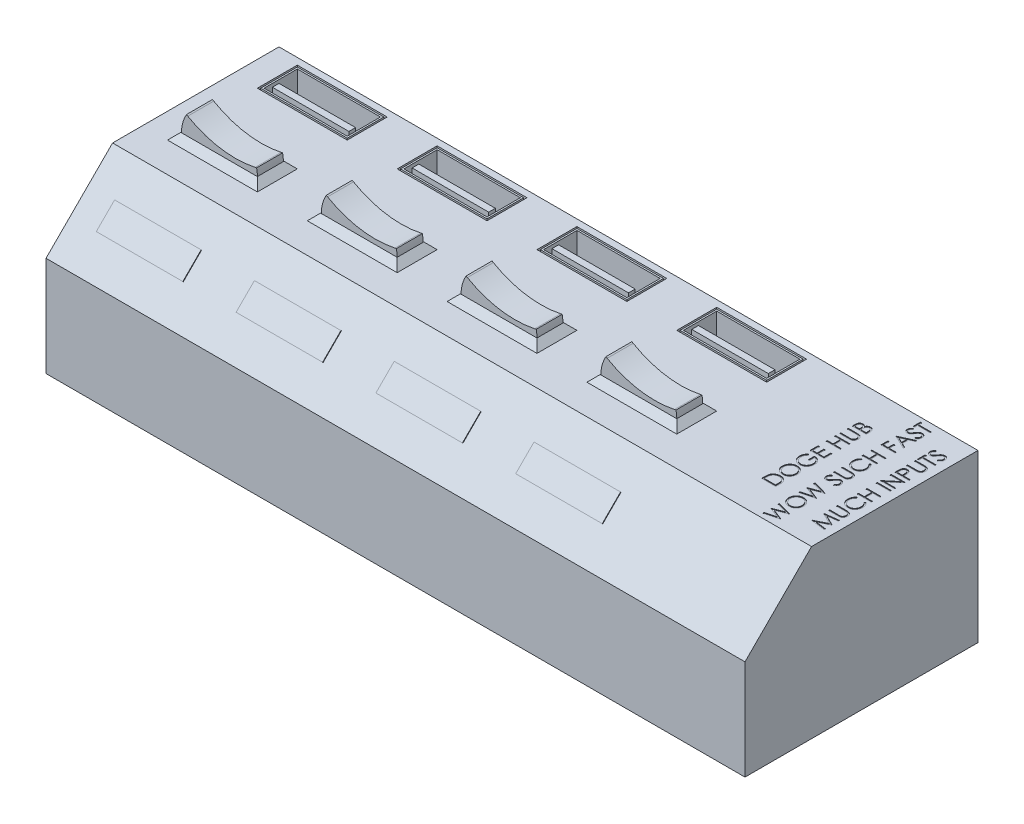
from build123d import *

# Parameters (mm, degrees)
ESBO_O1_W                = 105
ESBO_O1_H                = 35
RESSALTO_EXTRUS_O1_DEPTH = 25
CHANFRO1_SIZE            = 10
ESBO_O2_W                = 13.5
ESBO_O2_H                = 6
ESBO_O2_W_2              = 13
ESBO_O2_H_2              = 5.5
ESBO_O2_W_3              = 12.5
ESBO_O2_H_3              = 5
ESBO_O2_W_4              = 11.5
ESBO_O2_H_4              = 1
CORTE_EXTRUS_O1_DEPTH    = 15
ESBO_O3_W                = 13.5
ESBO_O3_H                = 6
RESSALTO_EXTRUS_O2_DEPTH = 1
RESSALTO_EXTRUS_O2_TAPER = 45
ESBO_O4_W                = 11.5
ESBO_O4_H                = 4
CORTE_EXTRUS_O2_DEPTH    = 1
RESSALTO_EXTRUS_O3_DEPTH = 1.95
ESBO_O6_W                = 13
ESBO_O6_H                = 3.889087296
RESSALTO_EXTRUS_O4_DEPTH = 0.1
PADR_O_LINEAR1_COUNT     = 4
PADR_O_LINEAR1_PITCH     = 21
ESBO_O8_W                = 2.116666666
ESBO_O8_H                = 0.189957265
CORTE_EXTRUS_O3_DEPTH    = 0.1


with BuildPart() as part:
    # Esboço1 → Ressalto-extrusão1 (new body)
    with BuildSketch(Plane(origin=(0, 0, 0), x_dir=(1, 0, 0), z_dir=(0, 1, 0))):
        Rectangle(ESBO_O1_W, ESBO_O1_H)
    extrude(amount=RESSALTO_EXTRUS_O1_DEPTH)

    # Chanfro1
    chanfro1_edges = [part.edges().sort_by_distance(p)[0] for p in [
        (0, 25, 17.5),
    ]]
    chamfer(chanfro1_edges, length=CHANFRO1_SIZE)

    # Esboço2 → Corte-extrusão1 (cut)
    # profile 1 of 8: a face of its own
    with BuildSketch(Plane(origin=(0, 25, 0), x_dir=(1, 0, 0), z_dir=(0, 1, 0))):
        with Locations((-42, 13.5)):
            Rectangle(ESBO_O2_W, ESBO_O2_H)
        with Locations((-42, 13.5)):
            Rectangle(ESBO_O2_W_2, ESBO_O2_H_2, mode=Mode.SUBTRACT)
    # profile 2 of 8: a face of its own
    with BuildSketch(Plane(origin=(0, 25, 0), x_dir=(1, 0, 0), z_dir=(0, 1, 0))):
        with Locations((-21, 13.5)):
            Rectangle(ESBO_O2_W, ESBO_O2_H)
        with Locations((-21, 13.5)):
            Rectangle(ESBO_O2_W_2, ESBO_O2_H_2, mode=Mode.SUBTRACT)
    # profile 3 of 8: a face of its own
    with BuildSketch(Plane(origin=(0, 25, 0), x_dir=(1, 0, 0), z_dir=(0, 1, 0))):
        with Locations((0, 13.5)):
            Rectangle(ESBO_O2_W, ESBO_O2_H)
        with Locations((0, 13.5)):
            Rectangle(ESBO_O2_W_2, ESBO_O2_H_2, mode=Mode.SUBTRACT)
    # profile 4 of 8: a face of its own
    with BuildSketch(Plane(origin=(0, 25, 0), x_dir=(1, 0, 0), z_dir=(0, 1, 0))):
        with Locations((21, 13.5)):
            Rectangle(ESBO_O2_W, ESBO_O2_H)
        with Locations((21, 13.5)):
            Rectangle(ESBO_O2_W_2, ESBO_O2_H_2, mode=Mode.SUBTRACT)
    # profile 5 of 8: a face of its own
    with BuildSketch(Plane(origin=(0, 25, 0), x_dir=(1, 0, 0), z_dir=(0, 1, 0))):
        with Locations((-42, 13.5)):
            Rectangle(ESBO_O2_W_3, ESBO_O2_H_3)
        with Locations((-42, 12.25)):
            Rectangle(ESBO_O2_W_4, ESBO_O2_H_4, mode=Mode.SUBTRACT)
    # profile 6 of 8: a face of its own
    with BuildSketch(Plane(origin=(0, 25, 0), x_dir=(1, 0, 0), z_dir=(0, 1, 0))):
        with Locations((-21, 13.5)):
            Rectangle(ESBO_O2_W_3, ESBO_O2_H_3)
        with Locations((-21, 12.25)):
            Rectangle(ESBO_O2_W_4, ESBO_O2_H_4, mode=Mode.SUBTRACT)
    # profile 7 of 8: a face of its own
    with BuildSketch(Plane(origin=(0, 25, 0), x_dir=(1, 0, 0), z_dir=(0, 1, 0))):
        with Locations((0, 13.5)):
            Rectangle(ESBO_O2_W_3, ESBO_O2_H_3)
        with Locations((0, 12.25)):
            Rectangle(ESBO_O2_W_4, ESBO_O2_H_4, mode=Mode.SUBTRACT)
    # profile 8 of 8: a face of its own
    with BuildSketch(Plane(origin=(0, 25, 0), x_dir=(1, 0, 0), z_dir=(0, 1, 0))):
        with Locations((21, 13.5)):
            Rectangle(ESBO_O2_W_3, ESBO_O2_H_3)
        with Locations((21, 12.25)):
            Rectangle(ESBO_O2_W_4, ESBO_O2_H_4, mode=Mode.SUBTRACT)
    extrude(amount=-CORTE_EXTRUS_O1_DEPTH, mode=Mode.SUBTRACT)

    # Esboço3 → Ressalto-extrusão2 (add)
    with BuildSketch(Plane(origin=(0, 25, 0), x_dir=(1, 0, 0), z_dir=(0, 1, 0))):
        with Locations((-42, 0)):
            Rectangle(ESBO_O3_W, ESBO_O3_H)
    ressalto_extrus_o2 = extrude(amount=RESSALTO_EXTRUS_O2_DEPTH, taper=RESSALTO_EXTRUS_O2_TAPER)

    # Esboço4 → Corte-extrusão2 (cut)
    with BuildSketch(Plane(origin=(0, 26, 0), x_dir=(1, 0, 0), z_dir=(0, 1, 0))):
        with Locations((-42, 0)):
            Rectangle(ESBO_O4_W, ESBO_O4_H)
    corte_extrus_o2 = extrude(amount=-CORTE_EXTRUS_O2_DEPTH, mode=Mode.SUBTRACT)

    # Esboço5 → Ressalto-extrusão3 (add, symmetric)
    with BuildSketch(Plane.XY):
        with BuildLine():
            Line((-47.65, 25), (-36.35, 25))
            ThreePointArc((-36.35, 25), (-36.290032036, 26.018489773), (-36.412191687, 27.031403685))
            Line((-36.412191687, 27.031403685), (-36.630697706, 26.984958797))
            ThreePointArc((-36.630697706, 26.984958797), (-41.840847735, 26.848526217), (-46.753834885, 28.588306213))
            Line((-46.753834885, 28.588306213), (-46.947294198, 28.7))
            ThreePointArc((-46.947294198, 28.7), (-47.612322254, 26.909573338), (-47.65, 25))
        make_face()
    ressalto_extrus_o3 = extrude(amount=RESSALTO_EXTRUS_O3_DEPTH, both=True)

    # Esboço6 → Ressalto-extrusão4 (add)
    with BuildSketch(Plane(origin=(0, 16.25, 16.25), x_dir=(1, 0, 0), z_dir=(0, 0.7071067811865467, 0.7071067811865485))):
        with Locations((-42, 5.303300859)):
            Rectangle(ESBO_O6_W, ESBO_O6_H)
    ressalto_extrus_o4 = extrude(amount=RESSALTO_EXTRUS_O4_DEPTH)

    # Padrão linear1: Ressalto-extrusão2, Corte-extrusão2, Ressalto-extrusão3, Ressalto-extrusão4 ×4
    with Locations(*[(i * PADR_O_LINEAR1_PITCH, 0, 0) for i in range(1, PADR_O_LINEAR1_COUNT)]):
        add(ressalto_extrus_o2)
        add(corte_extrus_o2, mode=Mode.SUBTRACT)
        add(ressalto_extrus_o3)
        add(ressalto_extrus_o4)

    # Esboço8 → Corte-extrusão3 (cut)
    # profile 1 of 28: a face of its own
    with BuildSketch(Plane(origin=(0, 25, 0), x_dir=(1, 0, 0), z_dir=(0, 1, 0))):
        with BuildLine():
            Line((39.883333333, 11.214316239), (39.883333333, 11.627303686))
            add(Edge.make_bspline(
                [(39.883333333, 11.627303686), (39.883437947, 11.647520275), (39.883640715, 11.686705056), (39.886858492, 11.743681052), (39.891136221, 11.797065581), (39.898311883, 11.846764304), (39.905752097, 11.893100606), (39.916672551, 11.935604074), (39.92873459, 11.974630728), (39.947293673, 12.021493752), (39.976116165, 12.074666273), (40.018862658, 12.131816785), (40.070112251, 12.181495496), (40.128515205, 12.223737127), (40.192765073, 12.257636934), (40.261479498, 12.281851682), (40.333502442, 12.297408158), (40.382880829, 12.298987932), (40.407835871, 12.299786325)],
                knots=[0, 0, 0, 0, 1.00128172, 1.940733171, 2.826250472, 3.653024905, 4.427672124, 5.149348099, 5.824709082, 6.450061444, 7.643590664, 8.808605388, 9.972104426, 11.165284501, 12.367876273, 13.557044126, 14.765369432, 16, 16, 16, 16], degree=3))
            add(Edge.make_bspline(
                [(40.407835871, 12.299786325), (40.431210436, 12.299121322), (40.477143661, 12.297814529), (40.544210451, 12.285470752), (40.607987047, 12.265879413), (40.668418866, 12.238803393), (40.724380966, 12.203917455), (40.77569999, 12.162119199), (40.820436362, 12.111898927), (40.845437106, 12.074253643), (40.858136351, 12.055131544)],
                knots=[0, 0, 0, 0, 1.044641374, 2.052818814, 3.038628718, 4.023282556, 5.005660861, 5.98021751, 6.974042014, 8, 8, 8, 8], degree=3))
            add(Edge.make_bspline(
                [(40.858136351, 12.055131544), (40.867371031, 12.079174814), (40.885039259, 12.125175545), (40.916227639, 12.188515781), (40.950272737, 12.242888404), (40.986877297, 12.289355556), (41.026915033, 12.328887075), (41.07071123, 12.363123655), (41.118230036, 12.392721847), (41.169296804, 12.417909703), (41.223478617, 12.437695078), (41.280113699, 12.452237054), (41.338984938, 12.460838949), (41.37893614, 12.46201238), (41.399175347, 12.462606838)],
                knots=[0, 0, 0, 0, 1.272586185, 2.434772614, 3.483318042, 4.437947805, 5.351807173, 6.25737843, 7.180033415, 8.1141739, 9.066731021, 10.025721652, 10.999834114, 12, 12, 12, 12], degree=3))
            add(Edge.make_bspline(
                [(41.399175347, 12.462606838), (41.419838254, 12.462016207), (41.460493102, 12.460854126), (41.520215244, 12.452276775), (41.577294031, 12.43776376), (41.632072354, 12.417738652), (41.684435362, 12.391782778), (41.734193363, 12.359738799), (41.781449877, 12.322056548), (41.826288305, 12.279469513), (41.867316877, 12.232009595), (41.902587612, 12.17970571), (41.932915418, 12.12399073), (41.957607236, 12.064152393), (41.976656957, 12.000343453), (41.989929373, 11.932599417), (41.998887312, 11.86103185), (41.999622811, 11.811918926), (42, 11.786732105)],
                knots=[0, 0, 0, 0, 0.978680899, 1.925582087, 2.851223405, 3.764209995, 4.683484765, 5.614004905, 6.562443559, 7.542772147, 8.539900013, 9.527881485, 10.525548727, 11.540192123, 12.58875426, 13.674701727, 14.807505862, 16, 16, 16, 16], degree=3))
            Line((42, 11.786732105), (42, 11.214316239))
            Line((42, 11.214316239), (39.883333333, 11.214316239))
        make_face()
        with BuildLine():
            Line((40.10042735, 11.404273504), (40.778846154, 11.404273504))
            Line((40.778846154, 11.404273504), (40.778846154, 11.531901042))
            add(Edge.make_bspline(
                [(40.778846154, 11.531901042), (40.778604296, 11.550557218), (40.778136976, 11.586604752), (40.776798325, 11.638807737), (40.773049986, 11.687264297), (40.769302718, 11.731890781), (40.763210008, 11.772616946), (40.755957572, 11.809352453), (40.748287618, 11.842674199), (40.735242441, 11.881099596), (40.715969283, 11.924692673), (40.686029877, 11.971134294), (40.650398204, 12.012266459), (40.608899612, 12.046583735), (40.563700349, 12.07491777), (40.515197221, 12.094766653), (40.464366291, 12.107999312), (40.429403411, 12.109212896), (40.411651976, 12.10982906)],
                knots=[0, 0, 0, 0, 1.156917035, 2.235399477, 3.236897345, 4.169954739, 5.01148057, 5.788325709, 6.491867502, 7.129259015, 8.302032419, 9.437271567, 10.542795419, 11.662606952, 12.764338259, 13.836858145, 14.901724648, 16, 16, 16, 16], degree=3))
            add(Edge.make_bspline(
                [(40.411651976, 12.10982906), (40.39990247, 12.10951621), (40.37685453, 12.10890252), (40.343146799, 12.103693813), (40.311473895, 12.095254324), (40.281531839, 12.083824981), (40.254064762, 12.068210803), (40.227760217, 12.050111919), (40.204193716, 12.027766277), (40.182230677, 12.002513718), (40.162573831, 11.973620286), (40.14629118, 11.940463472), (40.131533689, 11.90390043), (40.120609156, 11.862939185), (40.111002743, 11.818428468), (40.104966969, 11.769765587), (40.101082892, 11.717258908), (40.100650738, 11.680878375), (40.10042735, 11.66207265)],
                knots=[0, 0, 0, 0, 0.911708768, 1.788416306, 2.640049961, 3.452993646, 4.268229297, 5.087074648, 5.92553149, 6.781184137, 7.681934069, 8.628939405, 9.643570426, 10.73771997, 11.914765019, 13.176320755, 14.540391495, 16, 16, 16, 16], degree=3))
            Line((40.10042735, 11.66207265), (40.10042735, 11.404273504))
        make_face(mode=Mode.SUBTRACT)
        with BuildLine():
            Line((40.995940171, 11.404273504), (41.782905983, 11.404273504))
            Line((41.782905983, 11.404273504), (41.782905983, 11.674793002))
            add(Edge.make_bspline(
                [(41.782905983, 11.674793002), (41.782650831, 11.694154804), (41.782159059, 11.731472123), (41.781005752, 11.785394352), (41.776642967, 11.835241505), (41.772618317, 11.881170831), (41.765736339, 11.923060434), (41.759241541, 11.961232531), (41.749600478, 11.995060501), (41.73634997, 12.034647053), (41.715137553, 12.078895668), (41.68414641, 12.127251439), (41.645898557, 12.169416922), (41.602398867, 12.205612053), (41.555231929, 12.235481847), (41.50501436, 12.256916249), (41.452722796, 12.270236351), (41.417060429, 12.271843546), (41.399175347, 12.272649573)],
                knots=[0, 0, 0, 0, 1.160376723, 2.23647316, 3.230273494, 4.158083346, 4.997711197, 5.773399541, 6.476071462, 7.102777513, 8.27340052, 9.405620712, 10.53304798, 11.669441455, 12.787990954, 13.865552736, 14.929550474, 16, 16, 16, 16], degree=3))
            add(Edge.make_bspline(
                [(41.399175347, 12.272649573), (41.387991039, 12.272483107), (41.365802825, 12.27215286), (41.333200103, 12.267149699), (41.30160291, 12.259911712), (41.270879575, 12.250379074), (41.241546671, 12.237052961), (41.213491705, 12.220716262), (41.186149519, 12.202016009), (41.151135482, 12.173165054), (41.111294365, 12.130588405), (41.072769276, 12.070082236), (41.041198338, 12.001664439), (41.027851497, 11.951925712), (41.020956864, 11.926231971)],
                knots=[0, 0, 0, 0, 0.723302347, 1.434937762, 2.129609326, 2.821140842, 3.513216847, 4.209993937, 4.920569932, 5.655069131, 7.14393391, 8.6716197, 10.280644748, 12, 12, 12, 12], degree=3))
            add(Edge.make_bspline(
                [(41.020956864, 11.926231971), (41.018867361, 11.915933423), (41.014336887, 11.893604045), (41.00955461, 11.857192794), (41.005294026, 11.815623959), (41.002142516, 11.768801553), (40.99888494, 11.716666335), (40.997618072, 11.65910696), (40.996106614, 11.596358489), (40.995997071, 11.552820244), (40.995940171, 11.530204995)],
                knots=[0, 0, 0, 0, 0.634451884, 1.375622551, 2.216452059, 3.157844607, 4.20941857, 5.370758133, 6.634282058, 8, 8, 8, 8], degree=3))
            Line((40.995940171, 11.530204995), (40.995940171, 11.404273504))
        make_face(mode=Mode.SUBTRACT)
    # profile 2 of 28: a face of its own
    with BuildSketch(Plane(origin=(0, 25, 0), x_dir=(1, 0, 0), z_dir=(0, 1, 0))):
        with BuildLine():
            Line((39.883333333, 9.287606838), (39.883333333, 9.477564103))
            Line((39.883333333, 9.477564103), (41.151552484, 9.477564103))
            add(Edge.make_bspline(
                [(41.151552484, 9.477564103), (41.169502262, 9.477535834), (41.20356506, 9.477482188), (41.252047794, 9.477840518), (41.295150662, 9.478844041), (41.33303981, 9.479476718), (41.365541377, 9.480884201), (41.392831446, 9.482032068), (41.414780797, 9.483508023), (41.427590214, 9.485281861), (41.433096287, 9.486044338)],
                knots=[0, 0, 0, 0, 1.528628734, 2.90083645, 4.128790002, 5.200304208, 6.127813768, 6.898992206, 7.526736466, 8, 8, 8, 8], degree=3))
            add(Edge.make_bspline(
                [(41.433096287, 9.486044338), (41.453113064, 9.489139801), (41.491754551, 9.495115455), (41.546741118, 9.51099165), (41.596388996, 9.532157177), (41.641818067, 9.558414278), (41.682739623, 9.59159024), (41.719467744, 9.63277922), (41.752844269, 9.681242757), (41.781943801, 9.736286509), (41.806113414, 9.794935724), (41.824198488, 9.855087827), (41.835266542, 9.915581884), (41.836544753, 9.956087582), (41.837179487, 9.976201923)],
                knots=[0, 0, 0, 0, 1.042777144, 2.01303441, 2.939567723, 3.817555404, 4.708046775, 5.641195415, 6.651191522, 7.732783915, 8.843021186, 9.914367358, 10.964315445, 12, 12, 12, 12], degree=3))
            add(Edge.make_bspline(
                [(41.837179487, 9.976201923), (41.836533663, 9.993471656), (41.835245746, 10.027911375), (41.827172122, 10.079055511), (41.812908351, 10.129024379), (41.793478491, 10.177425429), (41.769584971, 10.223472064), (41.740960924, 10.265983705), (41.707619451, 10.304081038), (41.670667898, 10.338846977), (41.62902777, 10.36894306), (41.583703641, 10.395552704), (41.533486962, 10.416685653), (41.49821714, 10.427385201), (41.480161592, 10.43286258)],
                knots=[0, 0, 0, 0, 0.994718802, 1.98369237, 2.973235266, 3.981451368, 4.982709966, 5.955777334, 6.925228988, 7.892833478, 8.871333226, 9.877970804, 10.913677552, 12, 12, 12, 12], degree=3))
            add(Edge.make_bspline(
                [(41.480161592, 10.43286258), (41.472693645, 10.434676942), (41.456052048, 10.43872007), (41.427917744, 10.442498045), (41.394722748, 10.446432944), (41.356228556, 10.449163184), (41.312564158, 10.451824874), (41.263502088, 10.453417256), (41.209220498, 10.454153271), (41.171339929, 10.454372607), (41.151552484, 10.454487179)],
                knots=[0, 0, 0, 0, 0.558680831, 1.244966039, 2.062412453, 2.990489873, 4.051219941, 5.244515665, 6.560634259, 8, 8, 8, 8], degree=3))
            Line((41.151552484, 10.454487179), (39.883333333, 10.454487179))
            Line((39.883333333, 10.454487179), (39.883333333, 10.644444444))
            Line((39.883333333, 10.644444444), (41.161728766, 10.644444444))
            add(Edge.make_bspline(
                [(41.161728766, 10.644444444), (41.18476921, 10.64429074), (41.229734036, 10.643990777), (41.295623731, 10.641390256), (41.358127453, 10.63724233), (41.417254884, 10.631387031), (41.472790047, 10.62361105), (41.525098737, 10.615043693), (41.573892559, 10.603942513), (41.619734467, 10.591071897), (41.663592189, 10.57656847), (41.705133813, 10.557453876), (41.745579421, 10.53601162), (41.784476129, 10.510785935), (41.821576811, 10.481764883), (41.85784186, 10.450060294), (41.892190481, 10.414554672), (41.925046308, 10.376296742), (41.955602236, 10.335543732), (41.98219282, 10.292032502), (42.003844766, 10.246003271), (42.023061295, 10.198545979), (42.036719914, 10.148522809), (42.047105186, 10.096556871), (42.052956538, 10.042339928), (42.053830794, 10.00547173), (42.054273504, 9.986802217)],
                knots=[0, 0, 0, 0, 1.316707045, 2.569633854, 3.76780728, 4.896239288, 5.964314126, 6.972204208, 7.924543903, 8.822147865, 9.693191779, 10.560896119, 11.431827672, 12.307838457, 13.206132673, 14.12176355, 15.058527151, 16.026630406, 17.00238624, 17.966538933, 18.934743273, 19.906713913, 20.888635248, 21.892958714, 22.933025263, 24, 24, 24, 24], degree=3))
            add(Edge.make_bspline(
                [(42.054273504, 9.986802217), (42.053799237, 9.966440278), (42.052868726, 9.926490225), (42.047528405, 9.867625977), (42.037495208, 9.81118543), (42.024637177, 9.756617739), (42.00719312, 9.70445009), (41.985759027, 9.654697855), (41.961288753, 9.606789775), (41.932373266, 9.561805208), (41.900842873, 9.519375132), (41.866210195, 9.480815894), (41.829794219, 9.445148664), (41.790223703, 9.413945576), (41.74830869, 9.386026423), (41.703852034, 9.36200642), (41.656913333, 9.341374076), (41.624284235, 9.330726561), (41.607789129, 9.325343884)],
                knots=[0, 0, 0, 0, 1.138939089, 2.234594419, 3.301501784, 4.342532435, 5.367382236, 6.373123747, 7.370098489, 8.372230273, 9.360297234, 10.323289009, 11.268038109, 12.20748145, 13.137029304, 14.081414587, 15.030090602, 16, 16, 16, 16], degree=3))
            add(Edge.make_bspline(
                [(41.607789129, 9.325343884), (41.596520858, 9.322212936), (41.572079727, 9.315421839), (41.531629327, 9.308149398), (41.485053638, 9.30203581), (41.432349474, 9.296287211), (41.373475983, 9.292895127), (41.308458686, 9.289921247), (41.237218967, 9.287585887), (41.187595522, 9.287599659), (41.161728766, 9.287606838)],
                knots=[0, 0, 0, 0, 0.625038921, 1.35572334, 2.194682327, 3.136881307, 4.189498639, 5.346923369, 6.617055217, 8, 8, 8, 8], degree=3))
            Line((41.161728766, 9.287606838), (39.883333333, 9.287606838))
        make_face()
    # profile 3 of 28: a face of its own
    with BuildSketch(Plane(origin=(0, 25, 0), x_dir=(1, 0, 0), z_dir=(0, 1, 0))):
        Polygon((39.883333333, 7.279487179), (39.883333333, 7.469444444), (40.751709402, 7.469444444), (40.751709402, 8.55491453), (39.883333333, 8.55491453), (39.883333333, 8.744871795), (42, 8.744871795), (42, 8.55491453), (40.968803419, 8.55491453), (40.968803419, 7.469444444), (42, 7.469444444), (42, 7.279487179), align=None)
    # profile 4 of 28: a face of its own
    with BuildSketch(Plane(origin=(0, 25, 0), x_dir=(1, 0, 0), z_dir=(0, 1, 0))):
        Polygon((39.883333333, 4.891452991), (39.883333333, 6.085470085), (40.10042735, 6.085470085), (40.10042735, 5.081410256), (40.751709402, 5.081410256), (40.751709402, 6.085470085), (40.968803419, 6.085470085), (40.968803419, 5.081410256), (41.782905983, 5.081410256), (41.782905983, 6.085470085), (42, 6.085470085), (42, 4.891452991), align=None)
    # profile 5 of 28: a face of its own
    with BuildSketch(Plane(origin=(0, 25, 0), x_dir=(1, 0, 0), z_dir=(0, 1, 0))):
        with BuildLine():
            Line((40.244591346, 4.321581197), (40.398931624, 4.158760684))
            add(Edge.make_bspline(
                [(40.398931624, 4.158760684), (40.371205575, 4.129303288), (40.316414621, 4.071090924), (40.245438108, 3.976022387), (40.18403486, 3.87723099), (40.134447051, 3.774556994), (40.095547761, 3.670692765), (40.067271535, 3.567424255), (40.049364439, 3.465420093), (40.047213652, 3.397587396), (40.046153846, 3.36416266)],
                knots=[0, 0, 0, 0, 1.089067066, 2.152164705, 3.18986567, 4.218445106, 5.218487318, 6.173592265, 7.100032889, 8, 8, 8, 8], degree=3))
            add(Edge.make_bspline(
                [(40.046153846, 3.36416266), (40.046403979, 3.343652342), (40.046903597, 3.302684899), (40.053280336, 3.241832581), (40.062451468, 3.181618471), (40.07572108, 3.12215624), (40.09253894, 3.063330271), (40.113575865, 3.005345163), (40.138102124, 2.948092733), (40.166442791, 2.892112332), (40.197575738, 2.837840555), (40.232076897, 2.786583357), (40.268838272, 2.73801102), (40.308788405, 2.693047453), (40.351535579, 2.65139356), (40.396309953, 2.612283185), (40.443991844, 2.576445249), (40.494385173, 2.544522505), (40.546317561, 2.51569496), (40.599348572, 2.490783487), (40.652985904, 2.469126991), (40.707633438, 2.452632738), (40.762727781, 2.438662209), (40.818557653, 2.42893689), (40.875268848, 2.423435785), (40.913246503, 2.422486011), (40.932338408, 2.422008547)],
                knots=[0, 0, 0, 0, 1.028150113, 2.053633673, 3.06513288, 4.081487945, 5.106702018, 6.131327874, 7.172780699, 8.228344599, 9.276313556, 10.308389736, 11.324843658, 12.329040066, 13.321460474, 14.316307835, 15.308626991, 16.309440696, 17.305625405, 18.28535951, 19.246194545, 20.203493668, 21.145557131, 22.095268976, 23.042464743, 24, 24, 24, 24], degree=3))
            add(Edge.make_bspline(
                [(40.932338408, 2.422008547), (40.951854475, 2.422465865), (40.990833316, 2.423379252), (41.049009235, 2.429217138), (41.106314406, 2.440075765), (41.162838963, 2.454476204), (41.218695399, 2.472783965), (41.273825424, 2.495276581), (41.328223678, 2.522071242), (41.381350147, 2.553017676), (41.43305737, 2.587192449), (41.482171583, 2.624779118), (41.528121222, 2.665840961), (41.571577443, 2.709625084), (41.612265992, 2.756530415), (41.649696431, 2.807012027), (41.684447549, 2.860363271), (41.716137579, 2.916607815), (41.744444891, 2.975151174), (41.769617628, 3.035177683), (41.790348414, 3.096880271), (41.807244329, 3.15993436), (41.821093553, 3.224264866), (41.830003197, 3.290198307), (41.836468603, 3.357249898), (41.836941328, 3.402448975), (41.837179487, 3.425220353)],
                knots=[0, 0, 0, 0, 0.935915162, 1.869274651, 2.799799983, 3.730201895, 4.664668062, 5.616159355, 6.583070886, 7.570012957, 8.562524459, 9.553461134, 10.53281078, 11.515274572, 12.509912756, 13.507571325, 14.526460018, 15.561318395, 16.601025881, 17.643204557, 18.680545676, 19.719612342, 20.772381578, 21.833430283, 22.908478249, 24, 24, 24, 24], degree=3))
            add(Edge.make_bspline(
                [(41.837179487, 3.425220353), (41.836606062, 3.45266356), (41.835480049, 3.506552756), (41.826707451, 3.585766781), (41.813023824, 3.66185346), (41.792922112, 3.734565095), (41.767478298, 3.804165567), (41.736013395, 3.870398177), (41.698858465, 3.933445811), (41.656765891, 3.993035578), (41.609867533, 4.047750819), (41.559711782, 4.097548171), (41.50564883, 4.140715243), (41.448484407, 4.178541478), (41.387671722, 4.209806001), (41.323549082, 4.235475651), (41.256076809, 4.255150042), (41.209454795, 4.263226691), (41.185897436, 4.267307692)],
                knots=[0, 0, 0, 0, 1.130199668, 2.219330667, 3.279027493, 4.311506524, 5.322739849, 6.327972234, 7.327472899, 8.33386792, 9.329086447, 10.29244429, 11.240784345, 12.174119183, 13.111530729, 14.052100829, 15.015757696, 16, 16, 16, 16], degree=3))
            Line((41.185897436, 4.267307692), (41.185897436, 3.561752137))
            Line((41.185897436, 3.561752137), (40.968803419, 3.561752137))
            Line((40.968803419, 3.561752137), (40.968803419, 4.457264957))
            add(Edge.make_bspline(
                [(40.968803419, 4.457264957), (41.009266519, 4.456233325), (41.088460116, 4.454214235), (41.203951661, 4.440051367), (41.313033589, 4.417181381), (41.41582078, 4.385939192), (41.512167572, 4.34549557), (41.602171786, 4.296284565), (41.68525197, 4.237518568), (41.762086367, 4.171290825), (41.830623557, 4.096965612), (41.890861434, 4.016551256), (41.94160254, 3.929914899), (41.982883988, 3.837138492), (42.01510207, 3.738525753), (42.037944881, 3.633848495), (42.051630621, 3.52324867), (42.053379217, 3.447449823), (42.054273504, 3.408683894)],
                knots=[0, 0, 0, 0, 1.140356446, 2.231883559, 3.274166699, 4.278491846, 5.25512956, 6.21435461, 7.1637429, 8.11826594, 9.068280886, 10.0076534, 10.945064095, 11.891975133, 12.864533718, 13.863980011, 14.907571808, 16, 16, 16, 16], degree=3))
            add(Edge.make_bspline(
                [(42.054273504, 3.408683894), (42.053929321, 3.38478967), (42.053250482, 3.337662557), (42.048426086, 3.268059948), (42.040999261, 3.200376435), (42.029783877, 3.134621877), (42.01604692, 3.070554404), (41.99845638, 3.008493988), (41.978094833, 2.94820422), (41.954935069, 2.889591915), (41.928100781, 2.83318907), (41.89828019, 2.778744462), (41.865627062, 2.725957138), (41.829576694, 2.675186672), (41.79039873, 2.626168529), (41.748014645, 2.57921878), (41.702554016, 2.534074587), (41.670272424, 2.50579564), (41.65400641, 2.491546474)],
                knots=[0, 0, 0, 0, 1.107784379, 2.184907829, 3.233506516, 4.263428166, 5.276301166, 6.270063455, 7.25232949, 8.225834625, 9.190232166, 10.146266622, 11.1027726, 12.066435141, 13.031522626, 14.010570082, 14.99756817, 16, 16, 16, 16], degree=3))
            add(Edge.make_bspline(
                [(41.65400641, 2.491546474), (41.628200825, 2.470872125), (41.577018, 2.429866599), (41.49501232, 2.377084095), (41.410102623, 2.332088961), (41.322052538, 2.295580802), (41.230944424, 2.267073483), (41.1368947, 2.246628749), (41.039782257, 2.234650055), (40.974065645, 2.232924345), (40.940818643, 2.232051282)],
                knots=[0, 0, 0, 0, 1.023165419, 2.029347347, 3.013907458, 3.994755782, 4.975994455, 5.96558838, 6.970761222, 8, 8, 8, 8], degree=3))
            add(Edge.make_bspline(
                [(40.940818643, 2.232051282), (40.915922862, 2.232373159), (40.866447709, 2.233012823), (40.792994957, 2.240769208), (40.72084644, 2.251897681), (40.650061154, 2.268254722), (40.58059175, 2.288874796), (40.512406249, 2.314609702), (40.445463368, 2.344571891), (40.380227831, 2.379399958), (40.31755054, 2.41814629), (40.257738215, 2.460242348), (40.201760232, 2.506012958), (40.149486918, 2.555591396), (40.100143515, 2.607978249), (40.05476073, 2.664273298), (40.012628398, 2.723623625), (39.97455609, 2.786489314), (39.940346007, 2.851878367), (39.910357026, 2.919648643), (39.885571693, 2.989775514), (39.864541886, 3.061734656), (39.848990335, 3.136070464), (39.837712288, 3.212243578), (39.829995162, 3.290651026), (39.829374522, 3.343649958), (39.829059829, 3.370522837)],
                knots=[0, 0, 0, 0, 1.00895651, 2.005089799, 2.991467152, 3.967318338, 4.948153826, 5.927364234, 6.919980553, 7.91976625, 8.923240147, 9.905815003, 10.88314567, 11.851989312, 12.825009789, 13.798721852, 14.781296708, 15.773896486, 16.776076962, 17.771600213, 18.775744723, 19.78957137, 20.808953803, 21.851964491, 22.910847925, 24, 24, 24, 24], degree=3))
            add(Edge.make_bspline(
                [(39.829059829, 3.370522837), (39.829410284, 3.392438346), (39.830105194, 3.435894225), (39.834921909, 3.500558835), (39.842556352, 3.564223944), (39.852974456, 3.626983951), (39.867164402, 3.688625134), (39.884145079, 3.749323094), (39.903915848, 3.809165819), (39.927494817, 3.86796576), (39.954257724, 3.926118283), (39.984382984, 3.98394673), (40.018385725, 4.041253512), (40.05636691, 4.09813801), (40.097674216, 4.154958934), (40.143489057, 4.210817551), (40.192004723, 4.267062188), (40.226888711, 4.303228047), (40.244591346, 4.321581197)],
                knots=[0, 0, 0, 0, 0.985871117, 1.954866573, 2.915460327, 3.869826059, 4.81536089, 5.759505086, 6.70452669, 7.649098992, 8.607881297, 9.583363685, 10.581137262, 11.603961102, 12.659522466, 13.73993555, 14.853081303, 16, 16, 16, 16], degree=3))
        make_face()
    # profile 6 of 28: a face of its own
    with BuildSketch(Plane(origin=(0, 25, 0), x_dir=(1, 0, 0), z_dir=(0, 1, 0))):
        with BuildLine():
            add(Edge.make_bspline(
                [(39.829059829, 0.780235043), (39.830035822, 0.81943279), (39.831952751, 0.896420398), (39.847110979, 1.009463414), (39.872059837, 1.11770717), (39.90729295, 1.221213895), (39.952968255, 1.319589927), (40.00845067, 1.413113106), (40.074077372, 1.501503152), (40.148884695, 1.584151641), (40.230810923, 1.65954621), (40.318514504, 1.725705336), (40.410892773, 1.781516802), (40.507950547, 1.827204566), (40.609461223, 1.863072488), (40.715993718, 1.887817027), (40.826850276, 1.90362486), (40.902461808, 1.905472812), (40.940818643, 1.906410256)],
                knots=[0, 0, 0, 0, 1.065064174, 2.09187391, 3.093564831, 4.079973196, 5.057907931, 6.036227367, 7.030399151, 8.044883615, 9.061699972, 10.052012555, 11.025713132, 11.989727027, 12.962874294, 13.945865945, 14.957962116, 16, 16, 16, 16], degree=3))
            add(Edge.make_bspline(
                [(40.940818643, 1.906410256), (40.978892711, 1.905472497), (41.05394111, 1.903624063), (41.164097355, 1.8878042), (41.26997515, 1.862962077), (41.371338504, 1.82764866), (41.46819915, 1.781925837), (41.560647352, 1.726032208), (41.648585189, 1.659998645), (41.731075822, 1.584924239), (41.806535652, 1.502841941), (41.873094162, 1.41547543), (41.928929923, 1.323099625), (41.975127749, 1.226671812), (42.01024819, 1.125434809), (42.03581703, 1.020125319), (42.051467936, 0.910169583), (42.053328053, 0.835266767), (42.054273504, 0.797195513)],
                knots=[0, 0, 0, 0, 1.043748596, 2.057349401, 3.045489418, 4.02252776, 4.995289225, 5.97782527, 6.980224157, 8.006516136, 9.032559198, 10.034193337, 11.013412982, 11.987833483, 12.961212594, 13.946489799, 14.956251404, 16, 16, 16, 16], degree=3))
            add(Edge.make_bspline(
                [(42.054273504, 0.797195513), (42.053336494, 0.758838901), (42.051489398, 0.683227808), (42.035655881, 0.572231601), (42.010896141, 0.465625537), (41.975511863, 0.363714477), (41.929781442, 0.266441591), (41.874019746, 0.173616636), (41.807854475, 0.0856122), (41.732763261, 0.003157905), (41.651016656, -0.072285657), (41.563426416, -0.138059185), (41.471710973, -0.19383342), (41.375615803, -0.239410292), (41.275605455, -0.275493084), (41.171012804, -0.300109808), (41.062434151, -0.316036788), (40.988506303, -0.317872148), (40.950994925, -0.318803419)],
                knots=[0, 0, 0, 0, 1.053102029, 2.075944431, 3.073151272, 4.055350789, 5.033113405, 6.020478099, 7.024410459, 8.052272461, 9.079885166, 10.07527673, 11.055994387, 12.023226415, 12.992069828, 13.970394897, 14.97016774, 16, 16, 16, 16], degree=3))
            add(Edge.make_bspline(
                [(40.950994925, -0.318803419), (40.925817073, -0.318480092), (40.875778998, -0.317837516), (40.801473959, -0.310101588), (40.728363895, -0.298876178), (40.656656702, -0.282788355), (40.586527916, -0.26174768), (40.517493884, -0.236920978), (40.450254203, -0.206598309), (40.384490342, -0.172320013), (40.321227466, -0.134061681), (40.261428861, -0.09180349), (40.204592734, -0.047029719), (40.152191927, 0.002054809), (40.102702049, 0.053832374), (40.056883644, 0.109142917), (40.014323555, 0.167648941), (39.975969349, 0.229602189), (39.941280729, 0.293476098), (39.911513229, 0.359320626), (39.88596442, 0.426241505), (39.865256873, 0.494552173), (39.848908928, 0.56407123), (39.837776861, 0.634950405), (39.830021203, 0.707133229), (39.829381666, 0.755762932), (39.829059829, 0.780235043)],
                knots=[0, 0, 0, 0, 1.037015668, 2.060948919, 3.074880161, 4.083647147, 5.086022904, 6.090072063, 7.104153813, 8.122640571, 9.144368836, 10.147691507, 11.138137339, 12.123020368, 13.103399296, 14.087645067, 15.080126199, 16.082011238, 17.087798457, 18.072939717, 19.057185487, 20.037253025, 21.01195951, 21.997135196, 22.992090687, 24, 24, 24, 24], degree=3))
        make_face()
        with BuildLine():
            add(Edge.make_bspline(
                [(40.046153846, 0.789563301), (40.046397854, 0.769476099), (40.046883538, 0.729493731), (40.053316145, 0.670058785), (40.062418584, 0.611387458), (40.075638516, 0.553593287), (40.092737925, 0.496555066), (40.113361162, 0.440247472), (40.138287434, 0.384863567), (40.166320056, 0.330472539), (40.19816063, 0.278330643), (40.231972209, 0.228312308), (40.269011078, 0.181718551), (40.308476213, 0.137909306), (40.350710112, 0.096993521), (40.39543542, 0.058989244), (40.442845584, 0.02392764), (40.492745494, -0.007769339), (40.544856545, -0.035977177), (40.598182601, -0.061232837), (40.653350352, -0.082168815), (40.710015535, -0.098753229), (40.76792844, -0.112829596), (40.827404597, -0.121659336), (40.888238971, -0.128155324), (40.92935204, -0.128614104), (40.950146902, -0.128846154)],
                knots=[0, 0, 0, 0, 1.008406545, 2.007172654, 2.999155034, 3.989332444, 4.982025741, 5.988181096, 6.998684226, 8.030553839, 9.059268815, 10.065399129, 11.060956322, 12.046057109, 13.024974577, 14.012068307, 14.991706172, 15.984221787, 16.978487447, 17.966117052, 18.945677757, 19.938371053, 20.93015022, 21.936155317, 22.956113857, 24, 24, 24, 24], degree=3))
            add(Edge.make_bspline(
                [(40.950146902, -0.128846154), (40.980724311, -0.128073402), (41.040879536, -0.12655316), (41.129044475, -0.113299226), (41.213857207, -0.092721184), (41.294812213, -0.062886911), (41.372270495, -0.024827408), (41.445930613, 0.021597459), (41.515770838, 0.076812844), (41.581271279, 0.139495782), (41.641032327, 0.208037923), (41.693562601, 0.280784705), (41.737773545, 0.357160583), (41.774732901, 0.436725345), (41.802576542, 0.520158303), (41.822429045, 0.606924516), (41.835296017, 0.697025902), (41.836545706, 0.758424774), (41.837179487, 0.789563301)],
                knots=[0, 0, 0, 0, 1.032022337, 2.030307203, 3.003823408, 3.974715386, 4.937372378, 5.913284036, 6.909147208, 7.938749767, 8.970518239, 9.975863271, 10.963918693, 11.946286286, 12.933361397, 13.927862637, 14.949112547, 16, 16, 16, 16], degree=3))
            add(Edge.make_bspline(
                [(41.837179487, 0.789563301), (41.836892152, 0.810493892), (41.836322281, 0.852005539), (41.830574443, 0.913747815), (41.821375548, 0.974383482), (41.808065613, 1.033800507), (41.791627975, 1.092076739), (41.77123878, 1.149036338), (41.746797022, 1.204660386), (41.719557492, 1.259222397), (41.688614119, 1.311500677), (41.655258351, 1.361215612), (41.618873019, 1.407729095), (41.579937917, 1.451517786), (41.537833845, 1.49214682), (41.49338035, 1.530042891), (41.445869562, 1.56449827), (41.396174031, 1.596087797), (41.3444429, 1.624639813), (41.29097024, 1.649164946), (41.236042843, 1.670109916), (41.179620351, 1.686993936), (41.121829682, 1.70023107), (41.062588126, 1.709350386), (41.002015636, 1.7157298), (40.961046724, 1.716210616), (40.940394631, 1.716452991)],
                knots=[0, 0, 0, 0, 1.047334373, 2.07717862, 3.100662057, 4.115010574, 5.122652213, 6.129548646, 7.140165612, 8.16200981, 9.179904151, 10.178566626, 11.156366481, 12.133321541, 13.108841334, 14.082538371, 15.054589433, 16.043660176, 17.028268541, 18.009491307, 18.985652105, 19.968123554, 20.954864208, 21.950389976, 22.966808393, 24, 24, 24, 24], degree=3))
            add(Edge.make_bspline(
                [(40.940394631, 1.716452991), (40.919883826, 1.716210414), (40.879196867, 1.715729216), (40.819046753, 1.709353529), (40.760231715, 1.700221086), (40.702982654, 1.687059829), (40.647284973, 1.670096165), (40.593190991, 1.649179063), (40.540499165, 1.624513676), (40.489339805, 1.596205813), (40.440248238, 1.564385888), (40.393317914, 1.529615111), (40.349426225, 1.491295839), (40.307504443, 1.450512877), (40.26839109, 1.406285713), (40.232237294, 1.35860663), (40.197414085, 1.308662773), (40.166595159, 1.255324701), (40.137991435, 1.200475356), (40.113588069, 1.144142001), (40.092629033, 1.087129159), (40.075587471, 1.029208884), (40.062469222, 0.970408551), (40.053307999, 0.910762357), (40.046885747, 0.8504785), (40.046398587, 0.809932802), (40.046153846, 0.789563301)],
                knots=[0, 0, 0, 0, 1.029877221, 2.042951179, 3.035109885, 4.018542222, 4.991021277, 5.957494829, 6.929429462, 7.911425532, 8.892163142, 9.866273635, 10.842761649, 11.81676864, 12.802607151, 13.805177466, 14.821356543, 15.858816981, 16.897175917, 17.927346774, 18.940346092, 19.946830556, 20.957962087, 21.964146003, 22.97721996, 24, 24, 24, 24], degree=3))
        make_face(mode=Mode.SUBTRACT)
    # profile 7 of 28: a face of its own
    with BuildSketch(Plane(origin=(0, 25, 0), x_dir=(1, 0, 0), z_dir=(0, 1, 0))):
        with BuildLine():
            Line((42, -2.381196581), (39.883333333, -2.381196581))
            Line((39.883333333, -2.381196581), (39.883333333, -1.953792735))
            add(Edge.make_bspline(
                [(39.883333333, -1.953792735), (39.883600983, -1.916618633), (39.88411808, -1.84479846), (39.887396731, -1.74101379), (39.893196679, -1.644987419), (39.901644917, -1.557035166), (39.912018418, -1.476915576), (39.925021043, -1.404852989), (39.940374842, -1.340474789), (39.953465185, -1.300881365), (39.959655449, -1.28215812)],
                knots=[0, 0, 0, 0, 1.314313732, 2.53924729, 3.670748893, 4.714932338, 5.66265055, 6.526160246, 7.303039223, 8, 8, 8, 8], degree=3))
            add(Edge.make_bspline(
                [(39.959655449, -1.28215812), (39.968984446, -1.257666238), (39.987430889, -1.20923787), (40.022280935, -1.140322724), (40.061605366, -1.075225734), (40.106309145, -1.01446591), (40.155808518, -0.9578908), (40.209749859, -0.904858292), (40.269331454, -0.856675905), (40.333492785, -0.812593196), (40.401411766, -0.772836187), (40.472977161, -0.7382813), (40.54782058, -0.709582742), (40.625735232, -0.685759272), (40.706892072, -0.666983542), (40.7913857, -0.654173521), (40.878882161, -0.645724397), (40.938254337, -0.644875281), (40.968379407, -0.644444444)],
                knots=[0, 0, 0, 0, 0.984741985, 1.947153288, 2.898543998, 3.841229145, 4.778974371, 5.722123648, 6.681464302, 7.655713756, 8.646344578, 9.637374342, 10.639946623, 11.656849581, 12.698333139, 13.76849723, 14.867749466, 16, 16, 16, 16], degree=3))
            add(Edge.make_bspline(
                [(40.968379407, -0.644444444), (40.994542156, -0.64482482), (41.046098585, -0.645574391), (41.122081416, -0.652304973), (41.195810087, -0.66208781), (41.266933579, -0.677233531), (41.336074766, -0.695620016), (41.402497726, -0.719183307), (41.4668082, -0.74617988), (41.528149754, -0.777647639), (41.586227789, -0.81224099), (41.641017748, -0.849133761), (41.691303822, -0.889162651), (41.738403736, -0.931142927), (41.781059267, -0.976086937), (41.820047969, -1.023447494), (41.854717087, -1.073408654), (41.885611412, -1.126279691), (41.913239352, -1.182766711), (41.936284369, -1.244646517), (41.956243706, -1.311625996), (41.97212136, -1.384087116), (41.984926802, -1.46177143), (41.993452714, -1.544894436), (41.999234893, -1.633299042), (41.999740012, -1.694004808), (42, -1.725250401)],
                knots=[0, 0, 0, 0, 1.106010661, 2.179509527, 3.223302912, 4.248870533, 5.252098245, 6.246278179, 7.226402005, 8.199283979, 9.158616973, 10.083547221, 10.989831858, 11.874256832, 12.749262829, 13.607058236, 14.46581075, 15.317568432, 16.194266721, 17.121067875, 18.106207572, 19.147242834, 20.255495536, 21.43354536, 22.679031616, 24, 24, 24, 24], degree=3))
            Line((42, -1.725250401), (42, -2.381196581))
        make_face()
        with BuildLine():
            Line((41.782905983, -2.191239316), (41.782905983, -1.948280582))
            add(Edge.make_bspline(
                [(41.782905983, -1.948280582), (41.782755944, -1.913368663), (41.782467363, -1.846220256), (41.779935102, -1.749665182), (41.775797359, -1.66144288), (41.770006717, -1.581540824), (41.762345221, -1.510004129), (41.753803018, -1.446683289), (41.74316075, -1.391785871), (41.733514218, -1.35856664), (41.72905649, -1.343215812)],
                knots=[0, 0, 0, 0, 1.375205317, 2.645023457, 3.804390687, 4.853969522, 5.800190428, 6.637939096, 7.370582563, 8, 8, 8, 8], degree=3))
            add(Edge.make_bspline(
                [(41.72905649, -1.343215812), (41.722251978, -1.323894658), (41.708805478, -1.285713834), (41.684277732, -1.230752445), (41.655223786, -1.179494531), (41.622927877, -1.131047431), (41.586252409, -1.08609604), (41.545989343, -1.044116466), (41.501954728, -1.005160104), (41.454219968, -0.969826988), (41.403302687, -0.937823317), (41.349112836, -0.910349508), (41.292412242, -0.886423419), (41.232741881, -0.86747829), (41.170539105, -0.852540885), (41.105481367, -0.8420706), (41.037626234, -0.835570488), (40.991432221, -0.83479555), (40.967955395, -0.834401709)],
                knots=[0, 0, 0, 0, 0.998590647, 1.973329978, 2.929871262, 3.868367705, 4.809062953, 5.754642869, 6.701828697, 7.672172887, 8.647399344, 9.630604387, 10.631475358, 11.644913558, 12.679592956, 13.747988925, 14.855477812, 16, 16, 16, 16], degree=3))
            add(Edge.make_bspline(
                [(40.967955395, -0.834401709), (40.943200386, -0.834712126), (40.89456895, -0.835321942), (40.823212673, -0.842986882), (40.754583898, -0.854188014), (40.688678037, -0.870385767), (40.62536651, -0.891026822), (40.564999473, -0.916786439), (40.506939386, -0.946218156), (40.452526317, -0.981235888), (40.401065246, -1.019587223), (40.353921083, -1.062149084), (40.310986435, -1.108245269), (40.27159266, -1.157373011), (40.237324627, -1.210916876), (40.206671254, -1.267615536), (40.180656881, -1.328300776), (40.166820617, -1.370520835), (40.159788996, -1.391977163)],
                knots=[0, 0, 0, 0, 1.122418816, 2.205001699, 3.251619955, 4.274784885, 5.280384055, 6.268708349, 7.249350384, 8.229342522, 9.199999885, 10.157847722, 11.105861043, 12.055065948, 13.010012805, 13.98527497, 14.976112212, 16, 16, 16, 16], degree=3))
            add(Edge.make_bspline(
                [(40.159788996, -1.391977163), (40.154880489, -1.409727619), (40.144443658, -1.447469957), (40.13305879, -1.509058585), (40.123017021, -1.578373461), (40.114515255, -1.655722328), (40.108414827, -1.741017015), (40.103835984, -1.834323121), (40.100747688, -1.935680978), (40.100536803, -2.005943748), (40.10042735, -2.042411191)],
                knots=[0, 0, 0, 0, 0.674548936, 1.434276114, 2.292660221, 3.240891867, 4.284742987, 5.42552168, 6.663806718, 8, 8, 8, 8], degree=3))
            Line((40.10042735, -2.042411191), (40.10042735, -2.191239316))
            Line((40.10042735, -2.191239316), (41.782905983, -2.191239316))
        make_face(mode=Mode.SUBTRACT)
    # profile 8 of 28: a face of its own
    with BuildSketch(Plane(origin=(0, 25, 0), x_dir=(1, 0, 0), z_dir=(0, 1, 0))):
        Polygon((44.709615385, 15.73258547), (44.492521368, 15.73258547), (44.492521368, 16.845192308), (44.709615385, 16.845192308), (44.709615385, 16.383867521), (46.609188034, 16.383867521), (46.609188034, 16.193910256), (44.709615385, 16.193910256), align=None)
    # profile 9 of 28: a face of its own
    with BuildSketch(Plane(origin=(0, 25, 0), x_dir=(1, 0, 0), z_dir=(0, 1, 0))):
        with BuildLine():
            Line((46.200864717, 14.294337607), (46.093589744, 14.473270566))
            add(Edge.make_bspline(
                [(46.093589744, 14.473270566), (46.121447729, 14.489912548), (46.174822553, 14.521797942), (46.246945273, 14.574987574), (46.308245244, 14.630101287), (46.358365859, 14.687547217), (46.3978259, 14.746974719), (46.42576725, 14.808771742), (46.443194054, 14.872730037), (46.445310773, 14.916257062), (46.446367521, 14.937987447)],
                knots=[0, 0, 0, 0, 1.272034388, 2.437168799, 3.508375237, 4.49857839, 5.41946034, 6.295179144, 7.148887113, 8, 8, 8, 8], degree=3))
            add(Edge.make_bspline(
                [(46.446367521, 14.937987447), (46.445838351, 14.956541934), (46.44478927, 14.993326248), (46.435116224, 15.04758482), (46.41929114, 15.100017079), (46.397838525, 15.150101814), (46.371468598, 15.196512109), (46.340373505, 15.237862041), (46.304444237, 15.272777675), (46.265011806, 15.301723158), (46.222727014, 15.324120962), (46.179158543, 15.34104944), (46.1337086, 15.3505303), (46.103100094, 15.351952985), (46.087653579, 15.35267094)],
                knots=[0, 0, 0, 0, 1.09553864, 2.171907928, 3.244545276, 4.325730702, 5.384330216, 6.391480148, 7.371786628, 8.333890167, 9.27165687, 10.191402356, 11.087295184, 12, 12, 12, 12], degree=3))
            add(Edge.make_bspline(
                [(46.087653579, 15.35267094), (46.070024421, 15.351798483), (46.034323454, 15.350031662), (45.98156075, 15.334460552), (45.929120477, 15.31068412), (45.89667668, 15.288336945), (45.879887821, 15.276772837)],
                knots=[0, 0, 0, 0, 0.938992559, 1.901562324, 2.914110574, 4, 4, 4, 4], degree=3))
            add(Edge.make_bspline(
                [(45.879887821, 15.276772837), (45.867762732, 15.267297235), (45.842307627, 15.247404396), (45.804449089, 15.213176173), (45.76531891, 15.173216163), (45.724058046, 15.128071283), (45.681009203, 15.077665807), (45.635836451, 15.021980231), (45.589462899, 14.960539313), (45.55840159, 14.917414139), (45.542374466, 14.89516226)],
                knots=[0, 0, 0, 0, 0.72225051, 1.516274602, 2.393638633, 3.3469932, 4.386926276, 5.505032946, 6.712638081, 8, 8, 8, 8], degree=3))
            add(Edge.make_bspline(
                [(45.542374466, 14.89516226), (45.526512415, 14.87289251), (45.496185382, 14.830314443), (45.451176411, 14.770770443), (45.41002607, 14.717524506), (45.372346977, 14.670813292), (45.338134021, 14.630657345), (45.307715744, 14.596740234), (45.280269495, 14.569925964), (45.262464493, 14.555015208), (45.254470486, 14.548320646)],
                knots=[0, 0, 0, 0, 1.452282411, 2.77665338, 3.964542531, 5.026858415, 5.96415736, 6.766646006, 7.446254459, 8, 8, 8, 8], degree=3))
            add(Edge.make_bspline(
                [(45.254470486, 14.548320646), (45.242011145, 14.538965009), (45.21750818, 14.520565892), (45.179220531, 14.496252673), (45.140101455, 14.475749269), (45.100009176, 14.459247862), (45.059245011, 14.4459038), (45.017502918, 14.436626253), (44.975066268, 14.43090777), (44.94651433, 14.430317067), (44.932221554, 14.430021368)],
                knots=[0, 0, 0, 0, 1.068019517, 2.100403715, 3.106014851, 4.09224787, 5.069873182, 6.043214339, 7.020455327, 8, 8, 8, 8], degree=3))
            add(Edge.make_bspline(
                [(44.932221554, 14.430021368), (44.909827314, 14.430810673), (44.865517493, 14.432372413), (44.80078996, 14.445581236), (44.73898914, 14.466427229), (44.680741116, 14.495641274), (44.627509384, 14.533265458), (44.578814808, 14.576995323), (44.537319945, 14.628597755), (44.501630003, 14.685725483), (44.473406233, 14.747927724), (44.452952368, 14.813413158), (44.440803029, 14.881711053), (44.439107954, 14.928045476), (44.438247863, 14.951555823)],
                knots=[0, 0, 0, 0, 1.005248779, 1.989011071, 2.95484373, 3.928844559, 4.904706341, 5.875556129, 6.859318422, 7.868909462, 8.894684146, 9.918924798, 10.944050749, 12, 12, 12, 12], degree=3))
            add(Edge.make_bspline(
                [(44.438247863, 14.951555823), (44.439096487, 14.976502722), (44.440784128, 15.026114143), (44.455822912, 15.098973268), (44.479757818, 15.169408444), (44.507839734, 15.225817756), (44.535708332, 15.27005996), (44.561147405, 15.303766423), (44.590373305, 15.338108544), (44.624002158, 15.372717248), (44.661361353, 15.407934195), (44.70276714, 15.443597167), (44.747846384, 15.480039909), (44.780035911, 15.50347666), (44.796537794, 15.515491453)],
                knots=[0, 0, 0, 0, 1.286507425, 2.558452658, 3.822738219, 5.118007103, 5.800084425, 6.519418873, 7.295692132, 8.12638276, 9.008892966, 9.945018126, 10.946518512, 12, 12, 12, 12], degree=3))
            Line((44.796537794, 15.515491453), (44.926709402, 15.343766693))
            add(Edge.make_bspline(
                [(44.926709402, 15.343766693), (44.91335023, 15.333398243), (44.887623589, 15.313431031), (44.851607411, 15.28310457), (44.818663549, 15.254564465), (44.790124496, 15.226230382), (44.763853135, 15.200286305), (44.741759772, 15.174658808), (44.723146361, 15.15033686), (44.703246148, 15.119752682), (44.684116428, 15.081009534), (44.667313219, 15.03278055), (44.657344658, 14.982208952), (44.656015005, 14.947783048), (44.65534188, 14.930355235)],
                knots=[0, 0, 0, 0, 1.181392137, 2.275085037, 3.289537922, 4.225335853, 5.084247276, 5.86831218, 6.587234301, 7.222706459, 8.415108401, 9.595592188, 10.782789524, 12, 12, 12, 12], degree=3))
            add(Edge.make_bspline(
                [(44.65534188, 14.930355235), (44.656062671, 14.908483988), (44.657452649, 14.866307347), (44.673032751, 14.806568367), (44.696721247, 14.752489682), (44.73087981, 14.706135737), (44.771603398, 14.667862004), (44.818045781, 14.639832683), (44.869339586, 14.623074444), (44.905103382, 14.621023265), (44.923317308, 14.619978632)],
                knots=[0, 0, 0, 0, 1.144248881, 2.206576175, 3.214949548, 4.222996039, 5.203671638, 6.127710127, 7.046472867, 8, 8, 8, 8], degree=3))
            add(Edge.make_bspline(
                [(44.923317308, 14.619978632), (44.934654887, 14.620229962), (44.957487983, 14.620736123), (44.991061406, 14.627204041), (45.024457807, 14.635949197), (45.057559649, 14.649355941), (45.091116499, 14.668025942), (45.125602322, 14.692516985), (45.161314159, 14.723369426), (45.184541534, 14.747001484), (45.196804888, 14.759478499)],
                knots=[0, 0, 0, 0, 0.858259122, 1.72847414, 2.583651051, 3.473048463, 4.427392529, 5.488649985, 6.674082839, 8, 8, 8, 8], degree=3))
            add(Edge.make_bspline(
                [(45.196804888, 14.759478499), (45.200939661, 14.764111805), (45.210762934, 14.77511948), (45.226844932, 14.795243492), (45.2466828, 14.821818423), (45.271228462, 14.854150325), (45.299701537, 14.892835349), (45.33173796, 14.937877747), (45.368377737, 14.988775436), (45.393993964, 15.024892975), (45.407538729, 15.043990385)],
                knots=[0, 0, 0, 0, 0.420754252, 0.999615792, 1.744751191, 2.668019286, 3.750313428, 4.999500688, 6.413464383, 8, 8, 8, 8], degree=3))
            add(Edge.make_bspline(
                [(45.407538729, 15.043990385), (45.424255182, 15.066962802), (45.456624276, 15.111445703), (45.505256456, 15.17473884), (45.552820178, 15.232126249), (45.599008607, 15.283813661), (45.643481716, 15.330297488), (45.686740076, 15.371109148), (45.728500004, 15.406433812), (45.781674755, 15.444982698), (45.847586806, 15.483905645), (45.928377902, 15.517278873), (46.009400842, 15.53851035), (46.063787626, 15.541267733), (46.090621661, 15.542628205)],
                knots=[0, 0, 0, 0, 1.163604038, 2.253157948, 3.268574773, 4.215621239, 5.091738613, 5.902582348, 6.650434646, 7.330118262, 8.591011492, 9.77460283, 10.902005569, 12, 12, 12, 12], degree=3))
            add(Edge.make_bspline(
                [(46.090621661, 15.542628205), (46.1095979, 15.542230388), (46.147181872, 15.541442479), (46.202372389, 15.532400578), (46.255962091, 15.519122494), (46.307235566, 15.499270654), (46.357015511, 15.474645639), (46.404364167, 15.443846835), (46.450201418, 15.407960399), (46.493242207, 15.3668155), (46.532802238, 15.321816575), (46.567847287, 15.274084622), (46.597740995, 15.22411792), (46.621548402, 15.171375364), (46.640293895, 15.116423547), (46.653837912, 15.059081259), (46.662159672, 14.999290414), (46.663022738, 14.958649893), (46.663461538, 14.937987447)],
                knots=[0, 0, 0, 0, 0.983922938, 1.948738757, 2.895227473, 3.844781104, 4.796118043, 5.772795661, 6.770647148, 7.813532943, 8.8582745, 9.876489951, 10.882905461, 11.874265028, 12.874055871, 13.891769171, 14.928133632, 16, 16, 16, 16], degree=3))
            add(Edge.make_bspline(
                [(46.663461538, 14.937987447), (46.663152395, 14.922000358), (46.662538002, 14.890227522), (46.657106467, 14.843231788), (46.649421692, 14.797185467), (46.637221191, 14.752666345), (46.62241842, 14.709100895), (46.604192008, 14.666678399), (46.582349309, 14.625379029), (46.557377154, 14.584968539), (46.528307814, 14.545560535), (46.494480486, 14.507481913), (46.456757757, 14.46973093), (46.414556875, 14.43257538), (46.367413777, 14.396825878), (46.316030679, 14.361624194), (46.260254778, 14.327141883), (46.221031165, 14.305476604), (46.200864717, 14.294337607)],
                knots=[0, 0, 0, 0, 0.915313873, 1.819100311, 2.706792138, 3.586475221, 4.459428225, 5.3405999, 6.2277379, 7.133009489, 8.059106158, 9.028520402, 10.047404263, 11.114294124, 12.246039232, 13.433834781, 14.680630578, 16, 16, 16, 16], degree=3))
        make_face()
    # profile 10 of 28: a face of its own
    with BuildSketch(Plane(origin=(0, 25, 0), x_dir=(1, 0, 0), z_dir=(0, 1, 0))):
        Polygon((44.492521368, 13.208867521), (46.609188034, 14.185790598), (46.609188034, 13.979296875), (45.930769231, 13.666376202), (45.930769231, 12.706837607), (46.609188034, 12.385012687), (46.609188034, 12.17767094), (44.492521368, 13.181730769), align=None)
        Polygon((44.905084802, 13.193179087), (45.713675214, 12.809872463), (45.713675214, 13.566309428), align=None, mode=Mode.SUBTRACT)
    # profile 11 of 28: a face of its own
    with BuildSketch(Plane(origin=(0, 25, 0), x_dir=(1, 0, 0), z_dir=(0, 1, 0))):
        Polygon((44.492521368, 10.929380342), (44.492521368, 11.960576923), (44.709615385, 11.960576923), (44.709615385, 11.119337607), (45.360897436, 11.119337607), (45.360897436, 11.960576923), (45.577991453, 11.960576923), (45.577991453, 11.119337607), (46.609188034, 11.119337607), (46.609188034, 10.929380342), align=None)
    # profile 12 of 28: a face of its own
    with BuildSketch(Plane(origin=(0, 25, 0), x_dir=(1, 0, 0), z_dir=(0, 1, 0))):
        Polygon((44.492521368, 8.10715812), (44.492521368, 8.297115385), (45.360897436, 8.297115385), (45.360897436, 9.38258547), (44.492521368, 9.38258547), (44.492521368, 9.572542735), (46.609188034, 9.572542735), (46.609188034, 9.38258547), (45.577991453, 9.38258547), (45.577991453, 8.297115385), (46.609188034, 8.297115385), (46.609188034, 8.10715812), align=None)
    # profile 13 of 28: a face of its own
    with BuildSketch(Plane(origin=(0, 25, 0), x_dir=(1, 0, 0), z_dir=(0, 1, 0))):
        with BuildLine():
            Line((44.880916132, 7.672970085), (45.008119658, 7.506757479))
            add(Edge.make_bspline(
                [(45.008119658, 7.506757479), (44.993988997, 7.494900463), (44.965918186, 7.471346289), (44.926497333, 7.433454177), (44.889577664, 7.393955548), (44.854921964, 7.352905361), (44.823923117, 7.309353619), (44.794166906, 7.264959765), (44.768114321, 7.218110775), (44.736287828, 7.153656544), (44.703801021, 7.069010646), (44.675859563, 6.962823623), (44.658240322, 6.851822104), (44.656319094, 6.776110259), (44.65534188, 6.73760016)],
                knots=[0, 0, 0, 0, 0.75789156, 1.505565099, 2.245254514, 2.979266606, 3.711207489, 4.440978832, 5.174393176, 5.91211879, 7.394186119, 8.890401545, 10.418332761, 12, 12, 12, 12], degree=3))
            add(Edge.make_bspline(
                [(44.65534188, 6.73760016), (44.655586181, 6.716383117), (44.656072516, 6.674145946), (44.662488511, 6.611463297), (44.671506243, 6.549951119), (44.684886796, 6.489649423), (44.70180357, 6.430634966), (44.722017988, 6.372521945), (44.747027813, 6.316151715), (44.774670455, 6.260744532), (44.805892665, 6.207658872), (44.839949203, 6.157430839), (44.876456789, 6.110240687), (44.91556025, 6.066061848), (44.957054085, 6.024809532), (45.001403162, 5.987002839), (45.048133376, 5.952136642), (45.097283533, 5.920409653), (45.148395876, 5.891847994), (45.201762226, 5.86783208), (45.256468842, 5.846856743), (45.312903557, 5.829998015), (45.370691274, 5.8167577), (45.430071394, 5.807603956), (45.490931334, 5.801262318), (45.532181657, 5.800778212), (45.55297476, 5.800534188)],
                knots=[0, 0, 0, 0, 1.054877232, 2.099964208, 3.13098259, 4.145888998, 5.169474743, 6.183358035, 7.203388855, 8.234598956, 9.261847606, 10.264062591, 11.251197969, 12.227332808, 13.196685059, 14.158975844, 15.123498106, 16.094582253, 17.066912473, 18.032714859, 19.002806091, 19.979168736, 20.95977404, 21.949109834, 22.966205168, 24, 24, 24, 24], degree=3))
            add(Edge.make_bspline(
                [(45.55297476, 5.800534188), (45.584259194, 5.801299077), (45.645682031, 5.802800836), (45.735662729, 5.816109428), (45.821947048, 5.836495583), (45.903950764, 5.866548646), (45.982357479, 5.904345141), (46.05621635, 5.951504745), (46.126609432, 6.006330551), (46.191831844, 6.069385002), (46.25140835, 6.138575111), (46.30387202, 6.212807886), (46.347605247, 6.29190137), (46.383997383, 6.374981488), (46.411971685, 6.462687766), (46.431665228, 6.55486243), (46.444511689, 6.651305018), (46.445741586, 6.71720556), (46.446367521, 6.750744525)],
                knots=[0, 0, 0, 0, 1.029159485, 2.020618137, 2.987588728, 3.942669054, 4.889339625, 5.846988364, 6.821327795, 7.821533711, 8.827683044, 9.822769455, 10.807800696, 11.797391277, 12.803701919, 13.832062008, 14.896664671, 16, 16, 16, 16], degree=3))
            add(Edge.make_bspline(
                [(46.446367521, 6.750744525), (46.445346212, 6.787697103), (46.44333603, 6.860428618), (46.426306389, 6.967089281), (46.398694219, 7.06919472), (46.36005119, 7.166750427), (46.309816469, 7.25948138), (46.248918228, 7.347532694), (46.176777189, 7.430978691), (46.121693583, 7.481156562), (46.093589744, 7.506757479)],
                knots=[0, 0, 0, 0, 1.028121516, 2.023589091, 2.998037872, 3.967518031, 4.937445131, 5.927275754, 6.942489185, 8, 8, 8, 8], degree=3))
            Line((46.093589744, 7.506757479), (46.219521234, 7.672970085))
            add(Edge.make_bspline(
                [(46.219521234, 7.672970085), (46.236779605, 7.659593426), (46.271213681, 7.632904181), (46.319767812, 7.589696051), (46.365396683, 7.544145223), (46.407872426, 7.496134613), (46.447370855, 7.4455796), (46.483913425, 7.392484823), (46.517306205, 7.336895602), (46.547979113, 7.279253477), (46.574985568, 7.219425624), (46.598917233, 7.157938732), (46.618730008, 7.094415799), (46.635489393, 7.02939155), (46.647439588, 6.96227872), (46.656955787, 6.893857449), (46.662601502, 6.823487337), (46.663172288, 6.776053871), (46.663461538, 6.75201656)],
                knots=[0, 0, 0, 0, 0.986911346, 1.969095443, 2.935967484, 3.900112155, 4.865124501, 5.834589912, 6.812044781, 7.795288262, 8.784678562, 9.777857908, 10.776141921, 11.791195789, 12.811324908, 13.855933174, 14.913475973, 16, 16, 16, 16], degree=3))
            add(Edge.make_bspline(
                [(46.663461538, 6.75201656), (46.663303095, 6.729251104), (46.662989794, 6.684235234), (46.657914531, 6.617772656), (46.650990166, 6.553069433), (46.640563991, 6.490310493), (46.62826051, 6.429153356), (46.611767892, 6.370152431), (46.59329292, 6.312727137), (46.571578952, 6.257108188), (46.547076308, 6.203248274), (46.519383318, 6.151321112), (46.488732857, 6.101350584), (46.455800541, 6.052845401), (46.419528554, 6.0065221), (46.380420637, 5.961979254), (46.338608602, 5.91896709), (46.308458286, 5.892355942), (46.293299279, 5.878976362)],
                knots=[0, 0, 0, 0, 1.114604814, 2.203992996, 3.262667896, 4.300477797, 5.318619304, 6.316056647, 7.298880507, 8.271930387, 9.238335007, 10.195173496, 11.151986948, 12.108099108, 13.064862484, 14.031167946, 15.010108607, 16, 16, 16, 16], degree=3))
            add(Edge.make_bspline(
                [(46.293299279, 5.878976362), (46.266966683, 5.857547633), (46.214619402, 5.81494888), (46.129787783, 5.76042372), (46.041295255, 5.713906092), (45.948629252, 5.675875024), (45.851753752, 5.646662727), (45.7508246, 5.626124583), (45.646043557, 5.612871351), (45.57478136, 5.611350156), (45.53855836, 5.610576923)],
                knots=[0, 0, 0, 0, 0.994611881, 1.977215934, 2.950189954, 3.921972279, 4.908960509, 5.911694611, 6.938501887, 8, 8, 8, 8], degree=3))
            add(Edge.make_bspline(
                [(45.53855836, 5.610576923), (45.5004853, 5.611517445), (45.425578931, 5.613367863), (45.315648969, 5.62908913), (45.210328837, 5.654379544), (45.109815144, 5.69030052), (45.013579213, 5.735842328), (44.922356199, 5.79210128), (44.835562705, 5.85842379), (44.754515689, 5.9342897), (44.680408557, 6.017485183), (44.615211472, 6.10657799), (44.560953736, 6.201393739), (44.515598914, 6.300887868), (44.480737739, 6.405805399), (44.456333668, 6.515922484), (44.441143793, 6.631032209), (44.439223549, 6.709568057), (44.438247863, 6.749472489)],
                knots=[0, 0, 0, 0, 1.032925535, 2.032216505, 3.007276963, 3.968222605, 4.92396291, 5.891752235, 6.871517503, 7.883894988, 8.900124299, 9.891468569, 10.874487609, 11.85992873, 12.854644235, 13.869047385, 14.917252991, 16, 16, 16, 16], degree=3))
            add(Edge.make_bspline(
                [(44.438247863, 6.749472489), (44.438539696, 6.77379259), (44.439117348, 6.821931781), (44.444741673, 6.893145255), (44.454137224, 6.962472316), (44.466858184, 7.029985875), (44.482877666, 7.095881118), (44.502843073, 7.160034765), (44.526613292, 7.222289721), (44.55375778, 7.282625762), (44.584281602, 7.340635585), (44.61782472, 7.396282773), (44.654217649, 7.449345476), (44.693832971, 7.499547896), (44.736342081, 7.546951456), (44.781247045, 7.592259342), (44.829700157, 7.634152687), (44.863812889, 7.660007267), (44.880916132, 7.672970085)],
                knots=[0, 0, 0, 0, 1.096622143, 2.170653093, 3.219033441, 4.250379162, 5.267604342, 6.275621678, 7.278284436, 8.271072515, 9.257558938, 10.232633088, 11.19973724, 12.157384997, 13.114417402, 14.069920322, 15.032307892, 16, 16, 16, 16], degree=3))
        make_face()
    # profile 14 of 28: a face of its own
    with BuildSketch(Plane(origin=(0, 25, 0), x_dir=(1, 0, 0), z_dir=(0, 1, 0))):
        with BuildLine():
            Line((44.492521368, 3.79241453), (44.492521368, 3.982371795))
            Line((44.492521368, 3.982371795), (45.760740518, 3.982371795))
            add(Edge.make_bspline(
                [(45.760740518, 3.982371795), (45.778690296, 3.982343526), (45.812753094, 3.982289881), (45.861235828, 3.98264821), (45.904338696, 3.983651733), (45.942227845, 3.984284411), (45.974729411, 3.985691893), (46.00201948, 3.98683976), (46.023968831, 3.988315716), (46.036778248, 3.990089553), (46.042284322, 3.99085203)],
                knots=[0, 0, 0, 0, 1.528628734, 2.90083645, 4.128790002, 5.200304208, 6.127813768, 6.898992206, 7.526736466, 8, 8, 8, 8], degree=3))
            add(Edge.make_bspline(
                [(46.042284322, 3.99085203), (46.062301098, 3.993947494), (46.100942585, 3.999923147), (46.155929152, 4.015799343), (46.20557703, 4.036964869), (46.251006101, 4.063221971), (46.291927658, 4.096397932), (46.328655778, 4.137586912), (46.362032303, 4.186050449), (46.391131835, 4.241094201), (46.415301449, 4.299743416), (46.433386523, 4.359895519), (46.444454576, 4.420389577), (46.445732787, 4.460895275), (46.446367521, 4.481009615)],
                knots=[0, 0, 0, 0, 1.042777144, 2.01303441, 2.939567723, 3.817555404, 4.708046775, 5.641195415, 6.651191522, 7.732783915, 8.843021186, 9.914367358, 10.964315445, 12, 12, 12, 12], degree=3))
            add(Edge.make_bspline(
                [(46.446367521, 4.481009615), (46.445721698, 4.498279348), (46.44443378, 4.532719068), (46.436360156, 4.583863203), (46.422096385, 4.633832071), (46.402666525, 4.682233122), (46.378773006, 4.728279756), (46.350148958, 4.770791397), (46.316807486, 4.80888873), (46.279855932, 4.84365467), (46.238215804, 4.873750753), (46.192891675, 4.900360396), (46.142674996, 4.921493345), (46.107405174, 4.932192893), (46.089349626, 4.937670272)],
                knots=[0, 0, 0, 0, 0.994718802, 1.98369237, 2.973235266, 3.981451368, 4.982709966, 5.955777334, 6.925228988, 7.892833478, 8.871333226, 9.877970804, 10.913677552, 12, 12, 12, 12], degree=3))
            add(Edge.make_bspline(
                [(46.089349626, 4.937670272), (46.081881679, 4.939484634), (46.065240082, 4.943527763), (46.037105778, 4.947305737), (46.003910782, 4.951240636), (45.96541659, 4.953970876), (45.921752193, 4.956632566), (45.872690123, 4.958224949), (45.818408532, 4.958960964), (45.780527963, 4.959180299), (45.760740518, 4.959294872)],
                knots=[0, 0, 0, 0, 0.558680831, 1.244966039, 2.062412453, 2.990489873, 4.051219941, 5.244515665, 6.560634259, 8, 8, 8, 8], degree=3))
            Line((45.760740518, 4.959294872), (44.492521368, 4.959294872))
            Line((44.492521368, 4.959294872), (44.492521368, 5.149252137))
            Line((44.492521368, 5.149252137), (45.7709168, 5.149252137))
            add(Edge.make_bspline(
                [(45.7709168, 5.149252137), (45.793957244, 5.149098433), (45.838922071, 5.148798469), (45.904811765, 5.146197949), (45.967315487, 5.142050023), (46.026442919, 5.136194723), (46.081978081, 5.128418743), (46.134286771, 5.119851385), (46.183080593, 5.108750205), (46.228922502, 5.095879589), (46.272780223, 5.081376163), (46.314321847, 5.062261568), (46.354767455, 5.040819312), (46.393664163, 5.015593627), (46.430764845, 4.986572575), (46.467029894, 4.954867986), (46.501378515, 4.919362364), (46.534234342, 4.881104434), (46.56479027, 4.840351425), (46.591380855, 4.796840194), (46.6130328, 4.750810963), (46.632249329, 4.703353671), (46.645907948, 4.653330501), (46.65629322, 4.601364563), (46.662144572, 4.54714762), (46.663018828, 4.510279423), (46.663461538, 4.491609909)],
                knots=[0, 0, 0, 0, 1.316707045, 2.569633854, 3.76780728, 4.896239288, 5.964314126, 6.972204208, 7.924543903, 8.822147865, 9.693191779, 10.560896119, 11.431827672, 12.307838457, 13.206132673, 14.12176355, 15.058527151, 16.026630406, 17.00238624, 17.966538933, 18.934743273, 19.906713913, 20.888635248, 21.892958714, 22.933025263, 24, 24, 24, 24], degree=3))
            add(Edge.make_bspline(
                [(46.663461538, 4.491609909), (46.662987271, 4.47124797), (46.662056761, 4.431297918), (46.656716439, 4.372433669), (46.646683243, 4.315993122), (46.633825212, 4.261425431), (46.616381155, 4.209257782), (46.594947061, 4.159505547), (46.570476787, 4.111597467), (46.5415613, 4.066612901), (46.510030908, 4.024182824), (46.475398229, 3.985623586), (46.438982254, 3.949956357), (46.399411737, 3.918753268), (46.357496724, 3.890834116), (46.313040069, 3.866814112), (46.266101367, 3.846181769), (46.233472269, 3.835534253), (46.216977163, 3.830151576)],
                knots=[0, 0, 0, 0, 1.138939089, 2.234594419, 3.301501784, 4.342532435, 5.367382236, 6.373123747, 7.370098489, 8.372230273, 9.360297234, 10.323289009, 11.268038109, 12.20748145, 13.137029304, 14.081414587, 15.030090602, 16, 16, 16, 16], degree=3))
            add(Edge.make_bspline(
                [(46.216977163, 3.830151576), (46.205708892, 3.827020628), (46.181267761, 3.820229532), (46.140817361, 3.81295709), (46.094241673, 3.806843502), (46.041537508, 3.801094903), (45.982664017, 3.797702819), (45.917646721, 3.794728939), (45.846407001, 3.792393579), (45.796783556, 3.792407351), (45.7709168, 3.79241453)],
                knots=[0, 0, 0, 0, 0.625038921, 1.35572334, 2.194682327, 3.136881307, 4.189498639, 5.346923369, 6.617055217, 8, 8, 8, 8], degree=3))
            Line((45.7709168, 3.79241453), (44.492521368, 3.79241453))
        make_face()
    # profile 15 of 28: a face of its own
    with BuildSketch(Plane(origin=(0, 25, 0), x_dir=(1, 0, 0), z_dir=(0, 1, 0))):
        with BuildLine():
            Line((46.200864717, 2.109935897), (46.093589744, 2.288868857))
            add(Edge.make_bspline(
                [(46.093589744, 2.288868857), (46.121447729, 2.305510838), (46.174822553, 2.337396233), (46.246945273, 2.390585864), (46.308245244, 2.445699577), (46.358365859, 2.503145508), (46.3978259, 2.56257301), (46.42576725, 2.624370033), (46.443194054, 2.688328328), (46.445310773, 2.731855353), (46.446367521, 2.753585737)],
                knots=[0, 0, 0, 0, 1.272034388, 2.437168799, 3.508375237, 4.49857839, 5.41946034, 6.295179144, 7.148887113, 8, 8, 8, 8], degree=3))
            add(Edge.make_bspline(
                [(46.446367521, 2.753585737), (46.445838351, 2.772140224), (46.44478927, 2.808924539), (46.435116224, 2.863183111), (46.41929114, 2.91561537), (46.397838525, 2.965700105), (46.371468598, 3.012110399), (46.340373505, 3.053460332), (46.304444237, 3.088375966), (46.265011806, 3.117321449), (46.222727014, 3.139719253), (46.179158543, 3.156647731), (46.1337086, 3.16612859), (46.103100094, 3.167551276), (46.087653579, 3.168269231)],
                knots=[0, 0, 0, 0, 1.09553864, 2.171907928, 3.244545276, 4.325730702, 5.384330216, 6.391480148, 7.371786628, 8.333890167, 9.27165687, 10.191402356, 11.087295184, 12, 12, 12, 12], degree=3))
            add(Edge.make_bspline(
                [(46.087653579, 3.168269231), (46.070024421, 3.167396774), (46.034323454, 3.165629953), (45.98156075, 3.150058843), (45.929120477, 3.12628241), (45.89667668, 3.103935236), (45.879887821, 3.092371127)],
                knots=[0, 0, 0, 0, 0.938992559, 1.901562324, 2.914110574, 4, 4, 4, 4], degree=3))
            add(Edge.make_bspline(
                [(45.879887821, 3.092371127), (45.867762732, 3.082895526), (45.842307627, 3.063002687), (45.804449089, 3.028774463), (45.76531891, 2.988814453), (45.724058046, 2.943669574), (45.681009203, 2.893264098), (45.635836451, 2.837578522), (45.589462899, 2.776137603), (45.55840159, 2.73301243), (45.542374466, 2.71076055)],
                knots=[0, 0, 0, 0, 0.72225051, 1.516274602, 2.393638633, 3.3469932, 4.386926276, 5.505032946, 6.712638081, 8, 8, 8, 8], degree=3))
            add(Edge.make_bspline(
                [(45.542374466, 2.71076055), (45.526512415, 2.6884908), (45.496185382, 2.645912734), (45.451176411, 2.586368734), (45.41002607, 2.533122797), (45.372346977, 2.486411582), (45.338134021, 2.446255635), (45.307715744, 2.412338525), (45.280269495, 2.385524255), (45.262464493, 2.370613499), (45.254470486, 2.363918937)],
                knots=[0, 0, 0, 0, 1.452282411, 2.77665338, 3.964542531, 5.026858415, 5.96415736, 6.766646006, 7.446254459, 8, 8, 8, 8], degree=3))
            add(Edge.make_bspline(
                [(45.254470486, 2.363918937), (45.242011145, 2.354563299), (45.21750818, 2.336164183), (45.179220531, 2.311850964), (45.140101455, 2.29134756), (45.100009176, 2.274846153), (45.059245011, 2.261502091), (45.017502918, 2.252224544), (44.975066268, 2.24650606), (44.94651433, 2.245915357), (44.932221554, 2.245619658)],
                knots=[0, 0, 0, 0, 1.068019517, 2.100403715, 3.106014851, 4.09224787, 5.069873182, 6.043214339, 7.020455327, 8, 8, 8, 8], degree=3))
            add(Edge.make_bspline(
                [(44.932221554, 2.245619658), (44.909827314, 2.246408964), (44.865517493, 2.247970704), (44.80078996, 2.261179527), (44.73898914, 2.282025519), (44.680741116, 2.311239564), (44.627509384, 2.348863748), (44.578814808, 2.392593614), (44.537319945, 2.444196046), (44.501630003, 2.501323774), (44.473406233, 2.563526015), (44.452952368, 2.629011448), (44.440803029, 2.697309344), (44.439107954, 2.743643767), (44.438247863, 2.767154113)],
                knots=[0, 0, 0, 0, 1.005248779, 1.989011071, 2.95484373, 3.928844559, 4.904706341, 5.875556129, 6.859318422, 7.868909462, 8.894684146, 9.918924798, 10.944050749, 12, 12, 12, 12], degree=3))
            add(Edge.make_bspline(
                [(44.438247863, 2.767154113), (44.439096487, 2.792101013), (44.440784128, 2.841712433), (44.455822912, 2.914571559), (44.479757818, 2.985006734), (44.507839734, 3.041416046), (44.535708332, 3.08565825), (44.561147405, 3.119364714), (44.590373305, 3.153706835), (44.624002158, 3.188315539), (44.661361353, 3.223532486), (44.70276714, 3.259195458), (44.747846384, 3.2956382), (44.780035911, 3.31907495), (44.796537794, 3.331089744)],
                knots=[0, 0, 0, 0, 1.286507425, 2.558452658, 3.822738219, 5.118007103, 5.800084425, 6.519418873, 7.295692132, 8.12638276, 9.008892966, 9.945018126, 10.946518512, 12, 12, 12, 12], degree=3))
            Line((44.796537794, 3.331089744), (44.926709402, 3.159364984))
            add(Edge.make_bspline(
                [(44.926709402, 3.159364984), (44.91335023, 3.148996533), (44.887623589, 3.129029321), (44.851607411, 3.098702861), (44.818663549, 3.070162755), (44.790124496, 3.041828672), (44.763853135, 3.015884596), (44.741759772, 2.990257099), (44.723146361, 2.96593515), (44.703246148, 2.935350972), (44.684116428, 2.896607825), (44.667313219, 2.848378841), (44.657344658, 2.797807243), (44.656015005, 2.763381339), (44.65534188, 2.745953526)],
                knots=[0, 0, 0, 0, 1.181392137, 2.275085037, 3.289537922, 4.225335853, 5.084247276, 5.86831218, 6.587234301, 7.222706459, 8.415108401, 9.595592188, 10.782789524, 12, 12, 12, 12], degree=3))
            add(Edge.make_bspline(
                [(44.65534188, 2.745953526), (44.656062671, 2.724082278), (44.657452649, 2.681905638), (44.673032751, 2.622166657), (44.696721247, 2.568087973), (44.73087981, 2.521734028), (44.771603398, 2.483460294), (44.818045781, 2.455430973), (44.869339586, 2.438672735), (44.905103382, 2.436621556), (44.923317308, 2.435576923)],
                knots=[0, 0, 0, 0, 1.144248881, 2.206576175, 3.214949548, 4.222996039, 5.203671638, 6.127710127, 7.046472867, 8, 8, 8, 8], degree=3))
            add(Edge.make_bspline(
                [(44.923317308, 2.435576923), (44.934654887, 2.435828253), (44.957487983, 2.436334414), (44.991061406, 2.442802332), (45.024457807, 2.451547488), (45.057559649, 2.464954232), (45.091116499, 2.483624233), (45.125602322, 2.508115276), (45.161314159, 2.538967716), (45.184541534, 2.562599775), (45.196804888, 2.57507679)],
                knots=[0, 0, 0, 0, 0.858259122, 1.72847414, 2.583651051, 3.473048463, 4.427392529, 5.488649985, 6.674082839, 8, 8, 8, 8], degree=3))
            add(Edge.make_bspline(
                [(45.196804888, 2.57507679), (45.200939661, 2.579710096), (45.210762934, 2.590717771), (45.226844932, 2.610841783), (45.2466828, 2.637416713), (45.271228462, 2.669748616), (45.299701537, 2.708433639), (45.33173796, 2.753476038), (45.368377737, 2.804373726), (45.393993964, 2.840491266), (45.407538729, 2.859588675)],
                knots=[0, 0, 0, 0, 0.420754252, 0.999615792, 1.744751191, 2.668019286, 3.750313428, 4.999500688, 6.413464383, 8, 8, 8, 8], degree=3))
            add(Edge.make_bspline(
                [(45.407538729, 2.859588675), (45.424255182, 2.882561092), (45.456624276, 2.927043994), (45.505256456, 2.990337131), (45.552820178, 3.04772454), (45.599008607, 3.099411951), (45.643481716, 3.145895779), (45.686740076, 3.186707439), (45.728500004, 3.222032103), (45.781674755, 3.260580988), (45.847586806, 3.299503936), (45.928377902, 3.332877164), (46.009400842, 3.35410864), (46.063787626, 3.356866023), (46.090621661, 3.358226496)],
                knots=[0, 0, 0, 0, 1.163604038, 2.253157948, 3.268574773, 4.215621239, 5.091738613, 5.902582348, 6.650434646, 7.330118262, 8.591011492, 9.77460283, 10.902005569, 12, 12, 12, 12], degree=3))
            add(Edge.make_bspline(
                [(46.090621661, 3.358226496), (46.1095979, 3.357828679), (46.147181872, 3.35704077), (46.202372389, 3.347998869), (46.255962091, 3.334720785), (46.307235566, 3.314868945), (46.357015511, 3.290243929), (46.404364167, 3.259445125), (46.450201418, 3.223558689), (46.493242207, 3.18241379), (46.532802238, 3.137414865), (46.567847287, 3.089682913), (46.597740995, 3.039716211), (46.621548402, 2.986973654), (46.640293895, 2.932021838), (46.653837912, 2.87467955), (46.662159672, 2.814888705), (46.663022738, 2.774248184), (46.663461538, 2.753585737)],
                knots=[0, 0, 0, 0, 0.983922938, 1.948738757, 2.895227473, 3.844781104, 4.796118043, 5.772795661, 6.770647148, 7.813532943, 8.8582745, 9.876489951, 10.882905461, 11.874265028, 12.874055871, 13.891769171, 14.928133632, 16, 16, 16, 16], degree=3))
            add(Edge.make_bspline(
                [(46.663461538, 2.753585737), (46.663152395, 2.737598649), (46.662538002, 2.705825813), (46.657106467, 2.658830078), (46.649421692, 2.612783758), (46.637221191, 2.568264635), (46.62241842, 2.524699185), (46.604192008, 2.482276689), (46.582349309, 2.44097732), (46.557377154, 2.40056683), (46.528307814, 2.361158826), (46.494480486, 2.323080204), (46.456757757, 2.285329221), (46.414556875, 2.24817367), (46.367413777, 2.212424169), (46.316030679, 2.177222485), (46.260254778, 2.142740173), (46.221031165, 2.121074894), (46.200864717, 2.109935897)],
                knots=[0, 0, 0, 0, 0.915313873, 1.819100311, 2.706792138, 3.586475221, 4.459428225, 5.3405999, 6.2277379, 7.133009489, 8.059106158, 9.028520402, 10.047404263, 11.114294124, 12.246039232, 13.433834781, 14.680630578, 16, 16, 16, 16], degree=3))
        make_face()
    # profile 16 of 28: a face of its own
    with BuildSketch(Plane(origin=(0, 25, 0), x_dir=(1, 0, 0), z_dir=(0, 1, 0))):
        Polygon((44.492521368, -1.444978632), (44.492521368, -1.248661191), (46.044828392, -0.834401709), (44.492521368, -0.218312634), (44.492521368, -0.19075187), (46.034228098, 0.413888889), (44.492521368, 0.830268429), (44.492521368, 1.024465812), (46.609188034, 0.453745994), (46.609188034, 0.426609241), (44.990311165, -0.21025641), (46.609188034, -0.854754274), (46.609188034, -0.881891026), align=None)
    # profile 17 of 28: a face of its own
    with BuildSketch(Plane(origin=(0, 25, 0), x_dir=(1, 0, 0), z_dir=(0, 1, 0))):
        with BuildLine():
            add(Edge.make_bspline(
                [(44.438247863, -2.86965812), (44.439223856, -2.830460373), (44.441140785, -2.753472764), (44.456299014, -2.640429748), (44.481247871, -2.532185992), (44.516480985, -2.428679267), (44.562156289, -2.330303235), (44.617638704, -2.236780056), (44.683265406, -2.14839001), (44.758072729, -2.065741521), (44.839998957, -1.990346952), (44.927702538, -1.924187826), (45.020080807, -1.86837636), (45.117138581, -1.822688597), (45.218649258, -1.786820674), (45.325181752, -1.762076136), (45.43603831, -1.746268303), (45.511649842, -1.74442035), (45.550006677, -1.743482906)],
                knots=[0, 0, 0, 0, 1.065064174, 2.09187391, 3.093564831, 4.079973196, 5.057907931, 6.036227367, 7.030399151, 8.044883615, 9.061699972, 10.052012555, 11.025713132, 11.989727027, 12.962874294, 13.945865945, 14.957962116, 16, 16, 16, 16], degree=3))
            add(Edge.make_bspline(
                [(45.550006677, -1.743482906), (45.588080745, -1.744420666), (45.663129144, -1.746269099), (45.77328539, -1.762088962), (45.879163184, -1.786931085), (45.980526538, -1.822244503), (46.077387184, -1.867967326), (46.169835386, -1.923860954), (46.257773223, -1.989894518), (46.340263856, -2.064968923), (46.415723686, -2.147051222), (46.482282196, -2.234417732), (46.538117957, -2.326793538), (46.584315784, -2.423221351), (46.619436224, -2.524458354), (46.645005064, -2.629767843), (46.66065597, -2.73972358), (46.662516087, -2.814626395), (46.663461538, -2.85269765)],
                knots=[0, 0, 0, 0, 1.043748596, 2.057349401, 3.045489418, 4.02252776, 4.995289225, 5.97782527, 6.980224157, 8.006516136, 9.032559198, 10.034193337, 11.013412982, 11.987833483, 12.961212594, 13.946489799, 14.956251404, 16, 16, 16, 16], degree=3))
            add(Edge.make_bspline(
                [(46.663461538, -2.85269765), (46.662524528, -2.891054262), (46.660677432, -2.966665354), (46.644843916, -3.077661561), (46.620084175, -3.184267625), (46.584699897, -3.286178685), (46.538969476, -3.383451571), (46.48320778, -3.476276526), (46.417042509, -3.564280963), (46.341951295, -3.646735257), (46.26020469, -3.72217882), (46.17261445, -3.787952347), (46.080899007, -3.843726582), (45.984803838, -3.889303455), (45.884793489, -3.925386247), (45.780200838, -3.95000297), (45.671622185, -3.965929951), (45.597694337, -3.96776531), (45.560182959, -3.968696581)],
                knots=[0, 0, 0, 0, 1.053102029, 2.075944431, 3.073151272, 4.055350789, 5.033113405, 6.020478099, 7.024410459, 8.052272461, 9.079885166, 10.07527673, 11.055994387, 12.023226415, 12.992069828, 13.970394897, 14.97016774, 16, 16, 16, 16], degree=3))
            add(Edge.make_bspline(
                [(45.560182959, -3.968696581), (45.535005107, -3.968373254), (45.484967032, -3.967730679), (45.410661993, -3.95999475), (45.337551929, -3.94876934), (45.265844736, -3.932681517), (45.19571595, -3.911640842), (45.126681918, -3.88681414), (45.059442237, -3.856491472), (44.993678376, -3.822213175), (44.9304155, -3.783954844), (44.870616895, -3.741696652), (44.813780768, -3.696922882), (44.761379961, -3.647838353), (44.711890083, -3.596060789), (44.666071678, -3.540750246), (44.623511589, -3.482244222), (44.585157383, -3.420290973), (44.550468763, -3.356417064), (44.520701263, -3.290572536), (44.495152454, -3.223651658), (44.474444908, -3.155340989), (44.458096962, -3.085821932), (44.446964896, -3.014942758), (44.439209237, -2.942759933), (44.4385697, -2.894130231), (44.438247863, -2.86965812)],
                knots=[0, 0, 0, 0, 1.037015668, 2.060948919, 3.074880161, 4.083647147, 5.086022904, 6.090072063, 7.104153813, 8.122640571, 9.144368836, 10.147691507, 11.138137339, 12.123020368, 13.103399296, 14.087645067, 15.080126199, 16.082011238, 17.087798457, 18.072939717, 19.057185487, 20.037253025, 21.01195951, 21.997135196, 22.992090687, 24, 24, 24, 24], degree=3))
        make_face()
        with BuildLine():
            add(Edge.make_bspline(
                [(44.65534188, -2.860329861), (44.655585889, -2.880417063), (44.656071572, -2.920399432), (44.662504179, -2.979834377), (44.671606618, -3.038505704), (44.684826551, -3.096299875), (44.701925959, -3.153338096), (44.722549196, -3.20964569), (44.747475468, -3.265029596), (44.77550809, -3.319420624), (44.807348664, -3.371562519), (44.841160243, -3.421580854), (44.878199112, -3.468174611), (44.917664247, -3.511983856), (44.959898146, -3.552899641), (45.004623454, -3.590903918), (45.052033619, -3.625965522), (45.101933528, -3.657662502), (45.154044579, -3.685870339), (45.207370635, -3.711125999), (45.262538386, -3.732061977), (45.31920357, -3.748646391), (45.377116475, -3.762722759), (45.436592631, -3.771552498), (45.497427005, -3.778048486), (45.538540075, -3.778507267), (45.559334936, -3.778739316)],
                knots=[0, 0, 0, 0, 1.008406545, 2.007172654, 2.999155034, 3.989332444, 4.982025741, 5.988181096, 6.998684226, 8.030553839, 9.059268815, 10.065399129, 11.060956322, 12.046057109, 13.024974577, 14.012068307, 14.991706172, 15.984221787, 16.978487447, 17.966117052, 18.945677757, 19.938371053, 20.93015022, 21.936155317, 22.956113857, 24, 24, 24, 24], degree=3))
            add(Edge.make_bspline(
                [(45.559334936, -3.778739316), (45.589912346, -3.777966564), (45.65006757, -3.776446322), (45.738232509, -3.763192388), (45.823045241, -3.742614346), (45.904000247, -3.712780073), (45.981458529, -3.67472057), (46.055118647, -3.628295703), (46.124958872, -3.573080318), (46.190459314, -3.51039738), (46.250220361, -3.441855239), (46.302750635, -3.369108457), (46.34696158, -3.29273258), (46.383920935, -3.213167817), (46.411764576, -3.129734859), (46.431617079, -3.042968646), (46.444484051, -2.95286726), (46.44573374, -2.891468388), (46.446367521, -2.860329861)],
                knots=[0, 0, 0, 0, 1.032022337, 2.030307203, 3.003823408, 3.974715386, 4.937372378, 5.913284036, 6.909147208, 7.938749767, 8.970518239, 9.975863271, 10.963918693, 11.946286286, 12.933361397, 13.927862637, 14.949112547, 16, 16, 16, 16], degree=3))
            add(Edge.make_bspline(
                [(46.446367521, -2.860329861), (46.446080186, -2.839399271), (46.445510315, -2.797887623), (46.439762477, -2.736145348), (46.430563582, -2.67550968), (46.417253647, -2.616092655), (46.400816009, -2.557816423), (46.380426814, -2.500856824), (46.355985056, -2.445232777), (46.328745526, -2.390670765), (46.297802153, -2.338392486), (46.264446385, -2.28867755), (46.228061054, -2.242164067), (46.189125951, -2.198375376), (46.147021879, -2.157746342), (46.102568384, -2.119850271), (46.055057596, -2.085394892), (46.005362065, -2.053805366), (45.953630935, -2.025253349), (45.900158275, -2.000728217), (45.845230877, -1.979783246), (45.788808385, -1.962899227), (45.731017716, -1.949662092), (45.67177616, -1.940542777), (45.611203671, -1.934163362), (45.570234758, -1.933682546), (45.549582666, -1.933440171)],
                knots=[0, 0, 0, 0, 1.047334373, 2.07717862, 3.100662057, 4.115010574, 5.122652213, 6.129548646, 7.140165612, 8.16200981, 9.179904151, 10.178566626, 11.156366481, 12.133321541, 13.108841334, 14.082538371, 15.054589433, 16.043660176, 17.028268541, 18.009491307, 18.985652105, 19.968123554, 20.954864208, 21.950389976, 22.966808393, 24, 24, 24, 24], degree=3))
            add(Edge.make_bspline(
                [(45.549582666, -1.933440171), (45.529071861, -1.933682749), (45.488384901, -1.934163947), (45.428234787, -1.940539634), (45.369419749, -1.949672077), (45.312170688, -1.962833334), (45.256473007, -1.979796998), (45.202379025, -2.0007141), (45.149687199, -2.025379486), (45.098527839, -2.05368735), (45.049436272, -2.085507274), (45.002505948, -2.120278052), (44.958614259, -2.158597324), (44.916692477, -2.199380286), (44.877579124, -2.24360745), (44.841425328, -2.291286533), (44.806602119, -2.341230389), (44.775783193, -2.394568461), (44.747179469, -2.449417807), (44.722776103, -2.505751162), (44.701817068, -2.562764003), (44.684775505, -2.620684279), (44.671657256, -2.679484611), (44.662496033, -2.739130806), (44.656073782, -2.799414663), (44.655586622, -2.83996036), (44.65534188, -2.860329861)],
                knots=[0, 0, 0, 0, 1.029877221, 2.042951179, 3.035109885, 4.018542222, 4.991021277, 5.957494829, 6.929429462, 7.911425532, 8.892163142, 9.866273635, 10.842761649, 11.81676864, 12.802607151, 13.805177466, 14.821356543, 15.858816981, 16.897175917, 17.927346774, 18.940346092, 19.946830556, 20.957962087, 21.964146003, 22.97721996, 24, 24, 24, 24], degree=3))
        make_face(mode=Mode.SUBTRACT)
    # profile 18 of 28: a face of its own
    with BuildSketch(Plane(origin=(0, 25, 0), x_dir=(1, 0, 0), z_dir=(0, 1, 0))):
        Polygon((44.492521368, -6.818055556), (44.492521368, -6.621738114), (46.044828392, -6.207478632), (44.492521368, -5.591389557), (44.492521368, -5.563828793), (46.034228098, -4.959188034), (44.492521368, -4.542808494), (44.492521368, -4.348611111), (46.609188034, -4.919330929), (46.609188034, -4.946467682), (44.990311165, -5.583333333), (46.609188034, -6.227831197), (46.609188034, -6.254967949), align=None)
    # profile 19 of 28: a face of its own
    with BuildSketch(Plane(origin=(0, 25, 0), x_dir=(1, 0, 0), z_dir=(0, 1, 0))):
        with BuildLine():
            Line((50.810052751, 13.100320513), (50.702777778, 13.279253472))
            add(Edge.make_bspline(
                [(50.702777778, 13.279253472), (50.730635763, 13.295895454), (50.784010588, 13.327780848), (50.856133307, 13.38097048), (50.917433278, 13.436084193), (50.967553893, 13.493530123), (51.007013934, 13.552957625), (51.034955284, 13.614754648), (51.052382088, 13.678712943), (51.054498807, 13.722239968), (51.055555556, 13.743970353)],
                knots=[0, 0, 0, 0, 1.272034388, 2.437168799, 3.508375237, 4.49857839, 5.41946034, 6.295179144, 7.148887113, 8, 8, 8, 8], degree=3))
            add(Edge.make_bspline(
                [(51.055555556, 13.743970353), (51.055026386, 13.76252484), (51.053977305, 13.799309154), (51.044304258, 13.853567726), (51.028479174, 13.905999985), (51.00702656, 13.95608472), (50.980656632, 14.002495015), (50.949561539, 14.043844947), (50.913632271, 14.078760581), (50.87419984, 14.107706064), (50.831915048, 14.130103868), (50.788346577, 14.147032346), (50.742896634, 14.156513206), (50.712288128, 14.157935891), (50.696841613, 14.158653846)],
                knots=[0, 0, 0, 0, 1.09553864, 2.171907928, 3.244545276, 4.325730702, 5.384330216, 6.391480148, 7.371786628, 8.333890167, 9.27165687, 10.191402356, 11.087295184, 12, 12, 12, 12], degree=3))
            add(Edge.make_bspline(
                [(50.696841613, 14.158653846), (50.679212455, 14.157781389), (50.643511488, 14.156014568), (50.590748784, 14.140443458), (50.538308511, 14.116667026), (50.505864714, 14.094319851), (50.489075855, 14.082755743)],
                knots=[0, 0, 0, 0, 0.938992559, 1.901562324, 2.914110574, 4, 4, 4, 4], degree=3))
            add(Edge.make_bspline(
                [(50.489075855, 14.082755743), (50.476950767, 14.073280141), (50.451495661, 14.053387302), (50.413637123, 14.019159079), (50.374506944, 13.979199069), (50.33324608, 13.934054189), (50.290197237, 13.883648713), (50.245024485, 13.827963137), (50.198650933, 13.766522219), (50.167589624, 13.723397045), (50.1515625, 13.701145166)],
                knots=[0, 0, 0, 0, 0.72225051, 1.516274602, 2.393638633, 3.3469932, 4.386926276, 5.505032946, 6.712638081, 8, 8, 8, 8], degree=3))
            add(Edge.make_bspline(
                [(50.1515625, 13.701145166), (50.135700449, 13.678875416), (50.105373417, 13.636297349), (50.060364445, 13.576753349), (50.019214105, 13.523507412), (49.981535012, 13.476796198), (49.947322055, 13.436640251), (49.916903778, 13.40272314), (49.889457529, 13.37590887), (49.871652527, 13.360998114), (49.86365852, 13.354303552)],
                knots=[0, 0, 0, 0, 1.452282411, 2.77665338, 3.964542531, 5.026858415, 5.96415736, 6.766646006, 7.446254459, 8, 8, 8, 8], degree=3))
            add(Edge.make_bspline(
                [(49.86365852, 13.354303552), (49.85119918, 13.344947915), (49.826696214, 13.326548798), (49.788408565, 13.302235579), (49.74928949, 13.281732175), (49.70919721, 13.265230768), (49.668433045, 13.251886706), (49.626690953, 13.242609159), (49.584254303, 13.236890676), (49.555702365, 13.236299973), (49.541409589, 13.236004274)],
                knots=[0, 0, 0, 0, 1.068019517, 2.100403715, 3.106014851, 4.09224787, 5.069873182, 6.043214339, 7.020455327, 8, 8, 8, 8], degree=3))
            add(Edge.make_bspline(
                [(49.541409589, 13.236004274), (49.519015348, 13.236793579), (49.474705527, 13.238355319), (49.409977994, 13.251564142), (49.348177174, 13.272410135), (49.28992915, 13.30162418), (49.236697418, 13.339248364), (49.188002842, 13.382978229), (49.146507979, 13.434580661), (49.110818037, 13.491708389), (49.082594267, 13.55391063), (49.062140402, 13.619396064), (49.049991064, 13.687693959), (49.048295988, 13.734028382), (49.047435897, 13.757538729)],
                knots=[0, 0, 0, 0, 1.005248779, 1.989011071, 2.95484373, 3.928844559, 4.904706341, 5.875556129, 6.859318422, 7.868909462, 8.894684146, 9.918924798, 10.944050749, 12, 12, 12, 12], degree=3))
            add(Edge.make_bspline(
                [(49.047435897, 13.757538729), (49.048284521, 13.782485628), (49.049972162, 13.832097049), (49.065010946, 13.904956174), (49.088945852, 13.97539135), (49.117027768, 14.031800662), (49.144896366, 14.076042866), (49.170335439, 14.109749329), (49.199561339, 14.14409145), (49.233190192, 14.178700154), (49.270549387, 14.213917101), (49.311955174, 14.249580073), (49.357034418, 14.286022815), (49.389223945, 14.309459566), (49.405725828, 14.321474359)],
                knots=[0, 0, 0, 0, 1.286507425, 2.558452658, 3.822738219, 5.118007103, 5.800084425, 6.519418873, 7.295692132, 8.12638276, 9.008892966, 9.945018126, 10.946518512, 12, 12, 12, 12], degree=3))
            Line((49.405725828, 14.321474359), (49.535897436, 14.149749599))
            add(Edge.make_bspline(
                [(49.535897436, 14.149749599), (49.522538264, 14.139381149), (49.496811623, 14.119413937), (49.460795445, 14.089087476), (49.427851583, 14.060547371), (49.39931253, 14.032213288), (49.373041169, 14.006269211), (49.350947806, 13.980641714), (49.332334395, 13.956319766), (49.312434182, 13.925735588), (49.293304463, 13.88699244), (49.276501253, 13.838763456), (49.266532692, 13.788191858), (49.26520304, 13.753765954), (49.264529915, 13.736338141)],
                knots=[0, 0, 0, 0, 1.181392137, 2.275085037, 3.289537922, 4.225335853, 5.084247276, 5.86831218, 6.587234301, 7.222706459, 8.415108401, 9.595592188, 10.782789524, 12, 12, 12, 12], degree=3))
            add(Edge.make_bspline(
                [(49.264529915, 13.736338141), (49.265250705, 13.714466894), (49.266640683, 13.672290253), (49.282220785, 13.612551273), (49.305909281, 13.558472588), (49.340067845, 13.512118643), (49.380791432, 13.47384491), (49.427233815, 13.445815589), (49.478527621, 13.42905735), (49.514291416, 13.427006171), (49.532505342, 13.425961538)],
                knots=[0, 0, 0, 0, 1.144248881, 2.206576175, 3.214949548, 4.222996039, 5.203671638, 6.127710127, 7.046472867, 8, 8, 8, 8], degree=3))
            add(Edge.make_bspline(
                [(49.532505342, 13.425961538), (49.543842921, 13.426212868), (49.566676017, 13.426719029), (49.60024944, 13.433186947), (49.633645841, 13.441932103), (49.666747683, 13.455338847), (49.700304533, 13.474008848), (49.734790356, 13.498499891), (49.770502193, 13.529352332), (49.793729568, 13.55298439), (49.805992922, 13.565461405)],
                knots=[0, 0, 0, 0, 0.858259122, 1.72847414, 2.583651051, 3.473048463, 4.427392529, 5.488649985, 6.674082839, 8, 8, 8, 8], degree=3))
            add(Edge.make_bspline(
                [(49.805992922, 13.565461405), (49.810127695, 13.570094711), (49.819950968, 13.581102386), (49.836032967, 13.601226398), (49.855870834, 13.627801329), (49.880416497, 13.660133231), (49.908889571, 13.698818255), (49.940925994, 13.743860653), (49.977565771, 13.794758342), (50.003181998, 13.830875881), (50.016726763, 13.849973291)],
                knots=[0, 0, 0, 0, 0.420754252, 0.999615792, 1.744751191, 2.668019286, 3.750313428, 4.999500688, 6.413464383, 8, 8, 8, 8], degree=3))
            add(Edge.make_bspline(
                [(50.016726763, 13.849973291), (50.033443216, 13.872945708), (50.06581231, 13.917428609), (50.114444491, 13.980721746), (50.162008212, 14.038109155), (50.208196642, 14.089796567), (50.25266975, 14.136280394), (50.29592811, 14.177092054), (50.337688038, 14.212416718), (50.39086279, 14.250965604), (50.456774841, 14.289888551), (50.537565936, 14.323261779), (50.618588876, 14.344493256), (50.67297566, 14.347250639), (50.699809696, 14.348611111)],
                knots=[0, 0, 0, 0, 1.163604038, 2.253157948, 3.268574773, 4.215621239, 5.091738613, 5.902582348, 6.650434646, 7.330118262, 8.591011492, 9.77460283, 10.902005569, 12, 12, 12, 12], degree=3))
            add(Edge.make_bspline(
                [(50.699809696, 14.348611111), (50.718785934, 14.348213294), (50.756369906, 14.347425385), (50.811560424, 14.338383484), (50.865150126, 14.3251054), (50.9164236, 14.30525356), (50.966203545, 14.280628545), (51.013552201, 14.249829741), (51.059389452, 14.213943305), (51.102430242, 14.172798406), (51.141990273, 14.127799481), (51.177035322, 14.080067528), (51.206929029, 14.030100826), (51.230736436, 13.97735827), (51.249481929, 13.922406453), (51.263025946, 13.865064165), (51.271347706, 13.80527332), (51.272210773, 13.764632799), (51.272649573, 13.743970353)],
                knots=[0, 0, 0, 0, 0.983922938, 1.948738757, 2.895227473, 3.844781104, 4.796118043, 5.772795661, 6.770647148, 7.813532943, 8.8582745, 9.876489951, 10.882905461, 11.874265028, 12.874055871, 13.891769171, 14.928133632, 16, 16, 16, 16], degree=3))
            add(Edge.make_bspline(
                [(51.272649573, 13.743970353), (51.272340429, 13.727983264), (51.271726036, 13.696210428), (51.266294501, 13.649214694), (51.258609727, 13.603168373), (51.246409225, 13.558649251), (51.231606454, 13.515083801), (51.213380042, 13.472661304), (51.191537343, 13.431361935), (51.166565188, 13.390951445), (51.137495848, 13.351543441), (51.10366852, 13.313464819), (51.065945791, 13.275713836), (51.023744909, 13.238558286), (50.976601812, 13.202808784), (50.925218713, 13.1676071), (50.869442812, 13.133124789), (50.830219199, 13.11145951), (50.810052751, 13.100320513)],
                knots=[0, 0, 0, 0, 0.915313873, 1.819100311, 2.706792138, 3.586475221, 4.459428225, 5.3405999, 6.2277379, 7.133009489, 8.059106158, 9.028520402, 10.047404263, 11.114294124, 12.246039232, 13.433834781, 14.680630578, 16, 16, 16, 16], degree=3))
        make_face()
    # profile 20 of 28: a face of its own
    with BuildSketch(Plane(origin=(0, 25, 0), x_dir=(1, 0, 0), z_dir=(0, 1, 0))):
        Polygon((49.318803419, 11.824893162), (49.101709402, 11.824893162), (49.101709402, 12.9375), (49.318803419, 12.9375), (49.318803419, 12.476175214), (51.218376068, 12.476175214), (51.218376068, 12.286217949), (49.318803419, 12.286217949), align=None)
    # profile 21 of 28: a face of its own
    with BuildSketch(Plane(origin=(0, 25, 0), x_dir=(1, 0, 0), z_dir=(0, 1, 0))):
        with BuildLine():
            Line((49.101709402, 10.14241453), (49.101709402, 10.332371795))
            Line((49.101709402, 10.332371795), (50.369928552, 10.332371795))
            add(Edge.make_bspline(
                [(50.369928552, 10.332371795), (50.387878331, 10.332343526), (50.421941128, 10.332289881), (50.470423862, 10.33264821), (50.51352673, 10.333651733), (50.551415879, 10.334284411), (50.583917445, 10.335691893), (50.611207514, 10.33683976), (50.633156865, 10.338315716), (50.645966282, 10.340089553), (50.651472356, 10.34085203)],
                knots=[0, 0, 0, 0, 1.528628734, 2.90083645, 4.128790002, 5.200304208, 6.127813768, 6.898992206, 7.526736466, 8, 8, 8, 8], degree=3))
            add(Edge.make_bspline(
                [(50.651472356, 10.34085203), (50.671489132, 10.343947494), (50.710130619, 10.349923147), (50.765117186, 10.365799343), (50.814765065, 10.386964869), (50.860194135, 10.413221971), (50.901115692, 10.446397932), (50.937843812, 10.487586912), (50.971220338, 10.536050449), (51.00031987, 10.591094201), (51.024489483, 10.649743416), (51.042574557, 10.709895519), (51.053642611, 10.770389577), (51.054920821, 10.810895275), (51.055555556, 10.831009615)],
                knots=[0, 0, 0, 0, 1.042777144, 2.01303441, 2.939567723, 3.817555404, 4.708046775, 5.641195415, 6.651191522, 7.732783915, 8.843021186, 9.914367358, 10.964315445, 12, 12, 12, 12], degree=3))
            add(Edge.make_bspline(
                [(51.055555556, 10.831009615), (51.054909732, 10.848279348), (51.053621814, 10.882719068), (51.045548191, 10.933863203), (51.031284419, 10.983832071), (51.011854559, 11.032233122), (50.98796104, 11.078279756), (50.959336992, 11.120791397), (50.92599552, 11.15888873), (50.889043966, 11.19365467), (50.847403838, 11.223750753), (50.802079709, 11.250360396), (50.751863031, 11.271493345), (50.716593208, 11.282192893), (50.69853766, 11.287670272)],
                knots=[0, 0, 0, 0, 0.994718802, 1.98369237, 2.973235266, 3.981451368, 4.982709966, 5.955777334, 6.925228988, 7.892833478, 8.871333226, 9.877970804, 10.913677552, 12, 12, 12, 12], degree=3))
            add(Edge.make_bspline(
                [(50.69853766, 11.287670272), (50.691069713, 11.289484634), (50.674428117, 11.293527763), (50.646293812, 11.297305737), (50.613098816, 11.301240636), (50.574604625, 11.303970876), (50.530940227, 11.306632566), (50.481878157, 11.308224949), (50.427596566, 11.308960964), (50.389715997, 11.309180299), (50.369928552, 11.309294872)],
                knots=[0, 0, 0, 0, 0.558680831, 1.244966039, 2.062412453, 2.990489873, 4.051219941, 5.244515665, 6.560634259, 8, 8, 8, 8], degree=3))
            Line((50.369928552, 11.309294872), (49.101709402, 11.309294872))
            Line((49.101709402, 11.309294872), (49.101709402, 11.499252137))
            Line((49.101709402, 11.499252137), (50.380104834, 11.499252137))
            add(Edge.make_bspline(
                [(50.380104834, 11.499252137), (50.403145278, 11.499098433), (50.448110105, 11.498798469), (50.5139998, 11.496197949), (50.576503521, 11.492050023), (50.635630953, 11.486194723), (50.691166115, 11.478418743), (50.743474805, 11.469851385), (50.792268627, 11.458750205), (50.838110536, 11.445879589), (50.881968257, 11.431376163), (50.923509881, 11.412261568), (50.963955489, 11.390819312), (51.002852198, 11.365593627), (51.039952879, 11.336572575), (51.076217928, 11.304867986), (51.110566549, 11.269362364), (51.143422377, 11.231104434), (51.173978305, 11.190351425), (51.200568889, 11.146840194), (51.222220834, 11.100810963), (51.241437363, 11.053353671), (51.255095982, 11.003330501), (51.265481254, 10.951364563), (51.271332606, 10.89714762), (51.272206862, 10.860279423), (51.272649573, 10.841609909)],
                knots=[0, 0, 0, 0, 1.316707045, 2.569633854, 3.76780728, 4.896239288, 5.964314126, 6.972204208, 7.924543903, 8.822147865, 9.693191779, 10.560896119, 11.431827672, 12.307838457, 13.206132673, 14.12176355, 15.058527151, 16.026630406, 17.00238624, 17.966538933, 18.934743273, 19.906713913, 20.888635248, 21.892958714, 22.933025263, 24, 24, 24, 24], degree=3))
            add(Edge.make_bspline(
                [(51.272649573, 10.841609909), (51.272175305, 10.82124797), (51.271244795, 10.781297918), (51.265904473, 10.722433669), (51.255871277, 10.665993122), (51.243013246, 10.611425431), (51.225569189, 10.559257782), (51.204135095, 10.509505547), (51.179664821, 10.461597467), (51.150749334, 10.416612901), (51.119218942, 10.374182824), (51.084586263, 10.335623586), (51.048170288, 10.299956357), (51.008599771, 10.268753268), (50.966684758, 10.240834116), (50.922228103, 10.216814112), (50.875289401, 10.196181769), (50.842660303, 10.185534253), (50.826165198, 10.180151576)],
                knots=[0, 0, 0, 0, 1.138939089, 2.234594419, 3.301501784, 4.342532435, 5.367382236, 6.373123747, 7.370098489, 8.372230273, 9.360297234, 10.323289009, 11.268038109, 12.20748145, 13.137029304, 14.081414587, 15.030090602, 16, 16, 16, 16], degree=3))
            add(Edge.make_bspline(
                [(50.826165198, 10.180151576), (50.814896926, 10.177020628), (50.790455795, 10.170229532), (50.750005395, 10.16295709), (50.703429707, 10.156843502), (50.650725542, 10.151094903), (50.591852052, 10.147702819), (50.526834755, 10.144728939), (50.455595035, 10.142393579), (50.40597159, 10.142407351), (50.380104834, 10.14241453)],
                knots=[0, 0, 0, 0, 0.625038921, 1.35572334, 2.194682327, 3.136881307, 4.189498639, 5.346923369, 6.617055217, 8, 8, 8, 8], degree=3))
            Line((50.380104834, 10.14241453), (49.101709402, 10.14241453))
        make_face()
    # profile 22 of 28: a face of its own
    with BuildSketch(Plane(origin=(0, 25, 0), x_dir=(1, 0, 0), z_dir=(0, 1, 0))):
        with BuildLine():
            Line((49.101709402, 8.405662393), (49.101709402, 8.820769899))
            add(Edge.make_bspline(
                [(49.101709402, 8.820769899), (49.101740787, 8.849321256), (49.101800921, 8.904026925), (49.103624125, 8.982473649), (49.106059315, 9.053720487), (49.109435031, 9.117613812), (49.113424398, 9.174350215), (49.119019679, 9.223672962), (49.124861857, 9.265969742), (49.13080147, 9.291313166), (49.133510283, 9.302871261)],
                knots=[0, 0, 0, 0, 1.415646017, 2.712440637, 3.8905458, 4.950247383, 5.884950622, 6.709939814, 7.411656543, 8, 8, 8, 8], degree=3))
            add(Edge.make_bspline(
                [(49.133510283, 9.302871261), (49.137515143, 9.317502461), (49.145430493, 9.346420095), (49.161281287, 9.388090667), (49.180087013, 9.427728281), (49.201478947, 9.46550985), (49.226510099, 9.500747242), (49.253515251, 9.534615116), (49.284239593, 9.565917938), (49.317714069, 9.5950797), (49.353514119, 9.622033108), (49.392290183, 9.644678844), (49.432884587, 9.66447957), (49.47584904, 9.68069143), (49.521225257, 9.692747242), (49.568690765, 9.701697468), (49.618298936, 9.707404463), (49.652202265, 9.707949194), (49.669461138, 9.708226496)],
                knots=[0, 0, 0, 0, 0.999549623, 1.97554611, 2.93413192, 3.889860808, 4.833293765, 5.780583482, 6.742559327, 7.719844669, 8.705620613, 9.691528643, 10.674968152, 11.680406189, 12.713313868, 13.765869198, 14.862690416, 16, 16, 16, 16], degree=3))
            add(Edge.make_bspline(
                [(49.669461138, 9.708226496), (49.686864841, 9.707971634), (49.720916362, 9.70747298), (49.770732286, 9.701488084), (49.818338169, 9.693426492), (49.863628456, 9.681030655), (49.906334184, 9.664795415), (49.947107977, 9.645750221), (49.985256159, 9.622779229), (50.020917225, 9.596384498), (50.054124649, 9.567022344), (50.084637786, 9.534816995), (50.112278029, 9.499898471), (50.137107342, 9.462377743), (50.158549949, 9.421889025), (50.177755557, 9.379046389), (50.193885198, 9.333477449), (50.202370045, 9.301943643), (50.206684028, 9.285910791)],
                knots=[0, 0, 0, 0, 1.121902311, 2.195077645, 3.232258892, 4.234102512, 5.217864754, 6.176164875, 7.132989551, 8.084763148, 9.034132444, 9.988522005, 10.94243251, 11.903244335, 12.886203696, 13.894208494, 14.929344452, 16, 16, 16, 16], degree=3))
            add(Edge.make_bspline(
                [(50.206684028, 9.285910791), (50.209501919, 9.272649823), (50.215677493, 9.243587643), (50.222618664, 9.19572814), (50.228311184, 9.139977183), (50.233623488, 9.07652446), (50.236438345, 9.005222002), (50.239743447, 8.926233341), (50.241302944, 8.839291154), (50.241401523, 8.778651689), (50.241452991, 8.746991854)],
                knots=[0, 0, 0, 0, 0.601372724, 1.317943291, 2.144091499, 3.08771165, 4.142394186, 5.309582461, 6.595334295, 8, 8, 8, 8], degree=3))
            Line((50.241452991, 8.746991854), (50.241452991, 8.595619658))
            Line((50.241452991, 8.595619658), (51.218376068, 8.595619658))
            Line((51.218376068, 8.595619658), (51.218376068, 8.405662393))
            Line((51.218376068, 8.405662393), (49.101709402, 8.405662393))
        make_face()
        with BuildLine():
            Line((49.318803419, 8.595619658), (50.024358974, 8.595619658))
            Line((50.024358974, 8.595619658), (50.029023104, 8.966205929))
            add(Edge.make_bspline(
                [(50.029023104, 8.966205929), (50.029033067, 8.984300487), (50.029052302, 9.019231658), (50.026634006, 9.069689015), (50.023879556, 9.116508946), (50.019713611, 9.159515389), (50.014252718, 9.198859244), (50.00746155, 9.234200678), (50.00007847, 9.266068278), (49.987743176, 9.302725778), (49.968776395, 9.343930017), (49.941166014, 9.388942502), (49.905398085, 9.426794654), (49.865294674, 9.459489994), (49.82080143, 9.485946541), (49.772945908, 9.50461058), (49.722437082, 9.516103124), (49.687896005, 9.517538433), (49.670309161, 9.518269231)],
                knots=[0, 0, 0, 0, 1.160746174, 2.240796558, 3.240300023, 4.169675897, 5.012224395, 5.787635701, 6.478238024, 7.109103438, 8.265591281, 9.382545711, 10.479929969, 11.588830844, 12.694575677, 13.785760505, 14.872603606, 16, 16, 16, 16], degree=3))
            add(Edge.make_bspline(
                [(49.670309161, 9.518269231), (49.653292077, 9.517505623), (49.619464219, 9.515987664), (49.569886343, 9.504705421), (49.522573305, 9.485746124), (49.478438372, 9.459466865), (49.438423204, 9.42756499), (49.40360298, 9.390515383), (49.375798193, 9.34822326), (49.357160563, 9.309209777), (49.346248889, 9.274273683), (49.338367785, 9.244078037), (49.33293322, 9.209809509), (49.327733019, 9.171793703), (49.323535419, 9.130078886), (49.320620445, 9.084399928), (49.318932366, 9.034908945), (49.318847442, 9.000552237), (49.318803419, 8.982742388)],
                knots=[0, 0, 0, 0, 1.120540835, 2.227496496, 3.330685923, 4.466139262, 5.598993257, 6.692710361, 7.80064471, 8.921224235, 9.527843361, 10.209888745, 10.975318552, 11.811557897, 12.738105936, 13.73658638, 14.826690375, 16, 16, 16, 16], degree=3))
            Line((49.318803419, 8.982742388), (49.318803419, 8.595619658))
        make_face(mode=Mode.SUBTRACT)
    # profile 23 of 28: a face of its own
    with BuildSketch(Plane(origin=(0, 25, 0), x_dir=(1, 0, 0), z_dir=(0, 1, 0))):
        Polygon((51.218376068, 6.234722222), (49.101709402, 6.234722222), (49.101709402, 6.274579327), (50.767651576, 7.672970085), (49.101709402, 7.672970085), (49.101709402, 7.86292735), (51.218376068, 7.86292735), (51.218376068, 7.819678152), (49.55625, 6.424679487), (51.218376068, 6.424679487), align=None)
    # profile 24 of 28: a face of its own
    with BuildSketch(Plane(origin=(0, 25, 0), x_dir=(1, 0, 0), z_dir=(0, 1, 0))):
        with Locations((50.160042735, 5.678418804)):
            Rectangle(ESBO_O8_W, ESBO_O8_H)
    # profile 25 of 28: a face of its own
    with BuildSketch(Plane(origin=(0, 25, 0), x_dir=(1, 0, 0), z_dir=(0, 1, 0))):
        Polygon((49.101709402, 2.761217949), (49.101709402, 2.951175214), (49.97008547, 2.951175214), (49.97008547, 4.036645299), (49.101709402, 4.036645299), (49.101709402, 4.226602564), (51.218376068, 4.226602564), (51.218376068, 4.036645299), (50.187179487, 4.036645299), (50.187179487, 2.951175214), (51.218376068, 2.951175214), (51.218376068, 2.761217949), align=None)
    # profile 26 of 28: a face of its own
    with BuildSketch(Plane(origin=(0, 25, 0), x_dir=(1, 0, 0), z_dir=(0, 1, 0))):
        with BuildLine():
            Line((49.490104167, 2.327029915), (49.617307692, 2.160817308))
            add(Edge.make_bspline(
                [(49.617307692, 2.160817308), (49.603177031, 2.148960292), (49.57510622, 2.125406118), (49.535685368, 2.087514006), (49.498765698, 2.048015377), (49.464109998, 2.00696519), (49.433111151, 1.963413448), (49.403354941, 1.919019594), (49.377302355, 1.872170605), (49.345475862, 1.807716373), (49.312989055, 1.723070475), (49.285047597, 1.616883452), (49.267428356, 1.505881933), (49.265507128, 1.430170088), (49.264529915, 1.391659989)],
                knots=[0, 0, 0, 0, 0.75789156, 1.505565099, 2.245254514, 2.979266606, 3.711207489, 4.440978832, 5.174393176, 5.91211879, 7.394186119, 8.890401545, 10.418332761, 12, 12, 12, 12], degree=3))
            add(Edge.make_bspline(
                [(49.264529915, 1.391659989), (49.264774216, 1.370442946), (49.265260551, 1.328205775), (49.271676545, 1.265523126), (49.280694277, 1.204010948), (49.29407483, 1.143709252), (49.310991604, 1.084694795), (49.331206023, 1.026581774), (49.356215847, 0.970211544), (49.383858489, 0.914804361), (49.415080699, 0.861718701), (49.449137238, 0.811490668), (49.485644824, 0.764300517), (49.524748285, 0.720121677), (49.566242119, 0.678869361), (49.610591196, 0.641062668), (49.65732141, 0.606196472), (49.706471567, 0.574469482), (49.75758391, 0.545907823), (49.81095026, 0.521891909), (49.865656876, 0.500916572), (49.922091591, 0.484057844), (49.979879309, 0.470817529), (50.039259428, 0.461663785), (50.100119369, 0.455322147), (50.141369691, 0.454838041), (50.162162794, 0.454594017)],
                knots=[0, 0, 0, 0, 1.054877232, 2.099964208, 3.13098259, 4.145888998, 5.169474743, 6.183358035, 7.203388855, 8.234598956, 9.261847606, 10.264062591, 11.251197969, 12.227332808, 13.196685059, 14.158975844, 15.123498106, 16.094582253, 17.066912473, 18.032714859, 19.002806091, 19.979168736, 20.95977404, 21.949109834, 22.966205168, 24, 24, 24, 24], degree=3))
            add(Edge.make_bspline(
                [(50.162162794, 0.454594017), (50.193447228, 0.455358906), (50.254870065, 0.456860665), (50.344850763, 0.470169257), (50.431135082, 0.490555412), (50.513138799, 0.520608475), (50.591545513, 0.55840497), (50.665404385, 0.605564574), (50.735797466, 0.66039038), (50.801019878, 0.723444831), (50.860596384, 0.79263494), (50.913060054, 0.866867716), (50.956793281, 0.945961199), (50.993185417, 1.029041317), (51.021159719, 1.116747595), (51.040853262, 1.208922259), (51.053699723, 1.305364847), (51.05492962, 1.371265389), (51.055555556, 1.404804354)],
                knots=[0, 0, 0, 0, 1.029159485, 2.020618137, 2.987588728, 3.942669054, 4.889339625, 5.846988364, 6.821327795, 7.821533711, 8.827683044, 9.822769455, 10.807800696, 11.797391277, 12.803701919, 13.832062008, 14.896664671, 16, 16, 16, 16], degree=3))
            add(Edge.make_bspline(
                [(51.055555556, 1.404804354), (51.054534246, 1.441756932), (51.052524064, 1.514488447), (51.035494423, 1.62114911), (51.007882254, 1.723254549), (50.969239224, 1.820810257), (50.919004503, 1.913541209), (50.858106263, 2.001592523), (50.785965223, 2.08503852), (50.730881617, 2.135216391), (50.702777778, 2.160817308)],
                knots=[0, 0, 0, 0, 1.028121516, 2.023589091, 2.998037872, 3.967518031, 4.937445131, 5.927275754, 6.942489185, 8, 8, 8, 8], degree=3))
            Line((50.702777778, 2.160817308), (50.828709268, 2.327029915))
            add(Edge.make_bspline(
                [(50.828709268, 2.327029915), (50.845967639, 2.313653255), (50.880401715, 2.28696401), (50.928955846, 2.24375588), (50.974584717, 2.198205052), (51.017060461, 2.150194442), (51.056558889, 2.099639429), (51.093101459, 2.046544652), (51.126494239, 1.990955431), (51.157167147, 1.933313306), (51.184173603, 1.873485453), (51.208105267, 1.811998561), (51.227918042, 1.748475628), (51.244677427, 1.683451379), (51.256627622, 1.61633855), (51.266143821, 1.547917278), (51.271789536, 1.477547166), (51.272360322, 1.4301137), (51.272649573, 1.406076389)],
                knots=[0, 0, 0, 0, 0.986911346, 1.969095443, 2.935967484, 3.900112155, 4.865124501, 5.834589912, 6.812044781, 7.795288262, 8.784678562, 9.777857908, 10.776141921, 11.791195789, 12.811324908, 13.855933174, 14.913475973, 16, 16, 16, 16], degree=3))
            add(Edge.make_bspline(
                [(51.272649573, 1.406076389), (51.27249113, 1.383310933), (51.272177828, 1.338295063), (51.267102565, 1.271832485), (51.2601782, 1.207129262), (51.249752026, 1.144370322), (51.237448544, 1.083213185), (51.220955927, 1.02421226), (51.202480954, 0.966786966), (51.180766986, 0.911168017), (51.156264343, 0.857308103), (51.128571352, 0.805380941), (51.097920891, 0.755410413), (51.064988575, 0.70690523), (51.028716588, 0.660581929), (50.989608671, 0.616039083), (50.947796636, 0.573026919), (50.91764632, 0.546415771), (50.902487313, 0.533036191)],
                knots=[0, 0, 0, 0, 1.114604814, 2.203992996, 3.262667896, 4.300477797, 5.318619304, 6.316056647, 7.298880507, 8.271930387, 9.238335007, 10.195173496, 11.151986948, 12.108099108, 13.064862484, 14.031167946, 15.010108607, 16, 16, 16, 16], degree=3))
            add(Edge.make_bspline(
                [(50.902487313, 0.533036191), (50.876154717, 0.511607462), (50.823807437, 0.469008709), (50.738975817, 0.414483549), (50.650483289, 0.367965921), (50.557817286, 0.329934853), (50.460941787, 0.300722556), (50.360012634, 0.280184413), (50.255231591, 0.26693118), (50.183969395, 0.265409985), (50.147746394, 0.264636752)],
                knots=[0, 0, 0, 0, 0.994611881, 1.977215934, 2.950189954, 3.921972279, 4.908960509, 5.911694611, 6.938501887, 8, 8, 8, 8], degree=3))
            add(Edge.make_bspline(
                [(50.147746394, 0.264636752), (50.109673334, 0.265577274), (50.034766966, 0.267427692), (49.924837003, 0.283148959), (49.819516872, 0.308439374), (49.719003178, 0.344360349), (49.622767247, 0.389902157), (49.531544233, 0.446161109), (49.44475074, 0.512483619), (49.363703723, 0.588349529), (49.289596591, 0.671545012), (49.224399506, 0.760637819), (49.17014177, 0.855453568), (49.124786948, 0.954947697), (49.089925773, 1.059865228), (49.065521703, 1.169982314), (49.050331828, 1.285092038), (49.048411583, 1.363627886), (49.047435897, 1.403532318)],
                knots=[0, 0, 0, 0, 1.032925535, 2.032216505, 3.007276963, 3.968222605, 4.92396291, 5.891752235, 6.871517503, 7.883894988, 8.900124299, 9.891468569, 10.874487609, 11.85992873, 12.854644235, 13.869047385, 14.917252991, 16, 16, 16, 16], degree=3))
            add(Edge.make_bspline(
                [(49.047435897, 1.403532318), (49.04772773, 1.427852419), (49.048305383, 1.47599161), (49.053929707, 1.547205084), (49.063325259, 1.616532145), (49.076046218, 1.684045704), (49.092065701, 1.749940947), (49.112031107, 1.814094594), (49.135801326, 1.87634955), (49.162945814, 1.936685591), (49.193469636, 1.994695414), (49.227012754, 2.050342602), (49.263405684, 2.103405305), (49.303021006, 2.153607725), (49.345530116, 2.201011285), (49.390435079, 2.246319171), (49.438888191, 2.288212516), (49.473000923, 2.314067096), (49.490104167, 2.327029915)],
                knots=[0, 0, 0, 0, 1.096622143, 2.170653093, 3.219033441, 4.250379162, 5.267604342, 6.275621678, 7.278284436, 8.271072515, 9.257558938, 10.232633088, 11.19973724, 12.157384997, 13.114417402, 14.069920322, 15.032307892, 16, 16, 16, 16], degree=3))
        make_face()
    # profile 27 of 28: a face of its own
    with BuildSketch(Plane(origin=(0, 25, 0), x_dir=(1, 0, 0), z_dir=(0, 1, 0))):
        with BuildLine():
            Line((49.101709402, -1.553525641), (49.101709402, -1.363568376))
            Line((49.101709402, -1.363568376), (50.369928552, -1.363568376))
            add(Edge.make_bspline(
                [(50.369928552, -1.363568376), (50.387878331, -1.363596645), (50.421941128, -1.36365029), (50.470423862, -1.36329196), (50.51352673, -1.362288438), (50.551415879, -1.36165576), (50.583917445, -1.360248278), (50.611207514, -1.359100411), (50.633156865, -1.357624455), (50.645966282, -1.355850618), (50.651472356, -1.355088141)],
                knots=[0, 0, 0, 0, 1.528628734, 2.90083645, 4.128790002, 5.200304208, 6.127813768, 6.898992206, 7.526736466, 8, 8, 8, 8], degree=3))
            add(Edge.make_bspline(
                [(50.651472356, -1.355088141), (50.671489132, -1.351992677), (50.710130619, -1.346017024), (50.765117186, -1.330140828), (50.814765065, -1.308975302), (50.860194135, -1.2827182), (50.901115692, -1.249542239), (50.937843812, -1.208353259), (50.971220338, -1.159889722), (51.00031987, -1.10484597), (51.024489483, -1.046196755), (51.042574557, -0.986044652), (51.053642611, -0.925550594), (51.054920821, -0.885044896), (51.055555556, -0.864930556)],
                knots=[0, 0, 0, 0, 1.042777144, 2.01303441, 2.939567723, 3.817555404, 4.708046775, 5.641195415, 6.651191522, 7.732783915, 8.843021186, 9.914367358, 10.964315445, 12, 12, 12, 12], degree=3))
            add(Edge.make_bspline(
                [(51.055555556, -0.864930556), (51.054909732, -0.847660823), (51.053621814, -0.813221103), (51.045548191, -0.762076968), (51.031284419, -0.7121081), (51.011854559, -0.663707049), (50.98796104, -0.617660415), (50.959336992, -0.575148774), (50.92599552, -0.537051441), (50.889043966, -0.502285501), (50.847403838, -0.472189418), (50.802079709, -0.445579775), (50.751863031, -0.424446826), (50.716593208, -0.413747278), (50.69853766, -0.408269899)],
                knots=[0, 0, 0, 0, 0.994718802, 1.98369237, 2.973235266, 3.981451368, 4.982709966, 5.955777334, 6.925228988, 7.892833478, 8.871333226, 9.877970804, 10.913677552, 12, 12, 12, 12], degree=3))
            add(Edge.make_bspline(
                [(50.69853766, -0.408269899), (50.691069713, -0.406455537), (50.674428117, -0.402412408), (50.646293812, -0.398634434), (50.613098816, -0.394699535), (50.574604625, -0.391969295), (50.530940227, -0.389307605), (50.481878157, -0.387715222), (50.427596566, -0.386979207), (50.389715997, -0.386759872), (50.369928552, -0.386645299)],
                knots=[0, 0, 0, 0, 0.558680831, 1.244966039, 2.062412453, 2.990489873, 4.051219941, 5.244515665, 6.560634259, 8, 8, 8, 8], degree=3))
            Line((50.369928552, -0.386645299), (49.101709402, -0.386645299))
            Line((49.101709402, -0.386645299), (49.101709402, -0.196688034))
            Line((49.101709402, -0.196688034), (50.380104834, -0.196688034))
            add(Edge.make_bspline(
                [(50.380104834, -0.196688034), (50.403145278, -0.196841738), (50.448110105, -0.197141701), (50.5139998, -0.199742222), (50.576503521, -0.203890148), (50.635630953, -0.209745448), (50.691166115, -0.217521428), (50.743474805, -0.226088786), (50.792268627, -0.237189966), (50.838110536, -0.250060582), (50.881968257, -0.264564008), (50.923509881, -0.283678603), (50.963955489, -0.305120859), (51.002852198, -0.330346544), (51.039952879, -0.359367596), (51.076217928, -0.391072185), (51.110566549, -0.426577807), (51.143422377, -0.464835737), (51.173978305, -0.505588746), (51.200568889, -0.549099977), (51.222220834, -0.595129207), (51.241437363, -0.6425865), (51.255095982, -0.69260967), (51.265481254, -0.744575608), (51.271332606, -0.798792551), (51.272206862, -0.835660748), (51.272649573, -0.854330262)],
                knots=[0, 0, 0, 0, 1.316707045, 2.569633854, 3.76780728, 4.896239288, 5.964314126, 6.972204208, 7.924543903, 8.822147865, 9.693191779, 10.560896119, 11.431827672, 12.307838457, 13.206132673, 14.12176355, 15.058527151, 16.026630406, 17.00238624, 17.966538933, 18.934743273, 19.906713913, 20.888635248, 21.892958714, 22.933025263, 24, 24, 24, 24], degree=3))
            add(Edge.make_bspline(
                [(51.272649573, -0.854330262), (51.272175305, -0.874692201), (51.271244795, -0.914642253), (51.265904473, -0.973506502), (51.255871277, -1.029947049), (51.243013246, -1.08451474), (51.225569189, -1.136682389), (51.204135095, -1.186434624), (51.179664821, -1.234342703), (51.150749334, -1.27932727), (51.119218942, -1.321757347), (51.084586263, -1.360316585), (51.048170288, -1.395983814), (51.008599771, -1.427186903), (50.966684758, -1.455106055), (50.922228103, -1.479126059), (50.875289401, -1.499758402), (50.842660303, -1.510405918), (50.826165198, -1.515788595)],
                knots=[0, 0, 0, 0, 1.138939089, 2.234594419, 3.301501784, 4.342532435, 5.367382236, 6.373123747, 7.370098489, 8.372230273, 9.360297234, 10.323289009, 11.268038109, 12.20748145, 13.137029304, 14.081414587, 15.030090602, 16, 16, 16, 16], degree=3))
            add(Edge.make_bspline(
                [(50.826165198, -1.515788595), (50.814896926, -1.518919543), (50.790455795, -1.525710639), (50.750005395, -1.532983081), (50.703429707, -1.539096669), (50.650725542, -1.544845268), (50.591852052, -1.548237352), (50.526834755, -1.551211232), (50.455595035, -1.553546592), (50.40597159, -1.55353282), (50.380104834, -1.553525641)],
                knots=[0, 0, 0, 0, 0.625038921, 1.35572334, 2.194682327, 3.136881307, 4.189498639, 5.346923369, 6.617055217, 8, 8, 8, 8], degree=3))
            Line((50.380104834, -1.553525641), (49.101709402, -1.553525641))
        make_face()
    # profile 28 of 28: a face of its own
    with BuildSketch(Plane(origin=(0, 25, 0), x_dir=(1, 0, 0), z_dir=(0, 1, 0))):
        Polygon((51.218376068, -4.348611111), (49.101709402, -4.069187366), (49.101709402, -4.042050614), (50.838461538, -3.168162393), (49.101709402, -2.296394231), (49.101709402, -2.268833467), (51.218376068, -1.987713675), (51.218376068, -2.178518964), (49.695325855, -2.381196581), (51.218376068, -3.145265759), (51.218376068, -3.188090946), (49.691933761, -3.955128205), (51.218376068, -4.157381811), align=None)
    extrude(amount=-CORTE_EXTRUS_O3_DEPTH, mode=Mode.SUBTRACT)


solid = part.part
